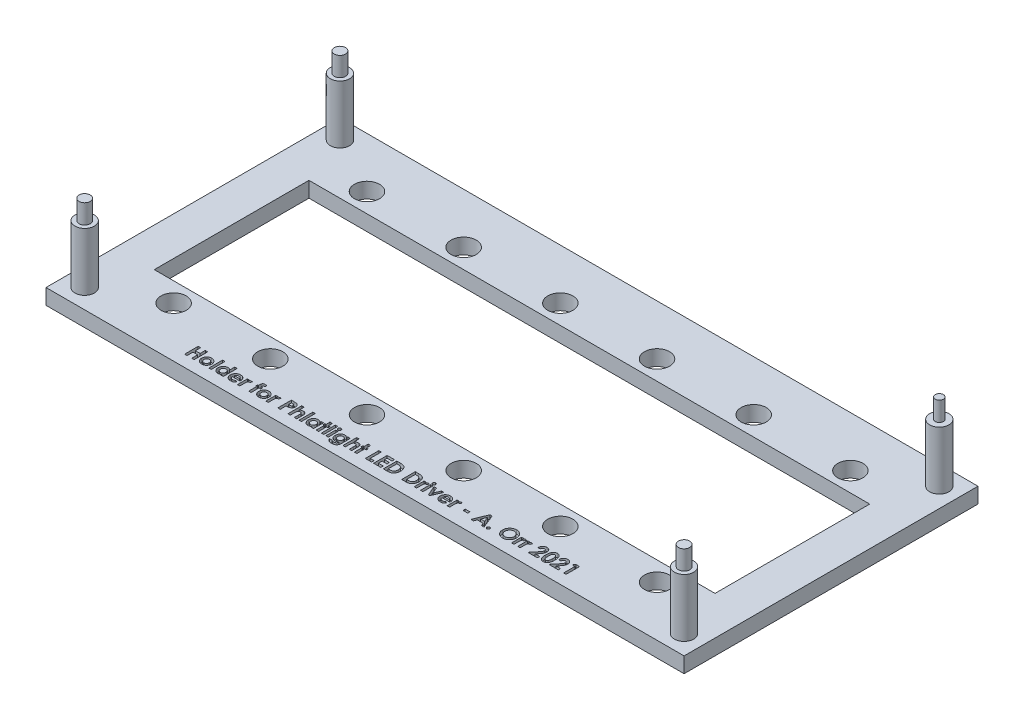
from build123d import *

# Parameters (mm, degrees)
SKETCH1_W           = 165
SKETCH1_H           = 76
BOSS_EXTRUDE1_DEPTH = 4
SKETCH2_R           = 2.5
BOSS_EXTRUDE2_DEPTH = 15
SKETCH3_R           = 1.05
SKETCH3_R_2         = 1.45
BOSS_EXTRUDE3_DEPTH = 5
SKETCH4_R           = 3.25
CUT_EXTRUDE1_DEPTH  = 97.717859219
SKETCH5_W           = 145
SKETCH5_H           = 40
CUT_EXTRUDE2_DEPTH  = 97.717859219
SKETCH6_W           = 0.628205128
SKETCH6_H           = 3.58974359
SKETCH6_W_2         = 0.628205129
SKETCH6_H_2         = 2.557692308
SKETCH6_W_3         = 1.211538461
SKETCH6_H_3         = 0.583333333
CUT_EXTRUDE3_DEPTH  = 1


with BuildPart() as part:
    # Sketch1 → Boss-Extrude1 (new body)
    with BuildSketch(Plane(origin=(0, 0, 0), x_dir=(1, 0, 0), z_dir=(0, 1, 0))):
        with Locations((1.371565063, 5.81671902)):
            Rectangle(SKETCH1_W, SKETCH1_H)
    extrude(amount=BOSS_EXTRUDE1_DEPTH)

    # Sketch2 → Boss-Extrude2 (add)
    with BuildSketch(Plane(origin=(0, 4, 0), x_dir=(1, 0, 0), z_dir=(0, 1, 0))):
        with Locations((-76.128434937, -27.18328098)):
            Circle(SKETCH2_R)
        with Locations((78.871565063, -27.18328098)):
            Circle(SKETCH2_R)
        with Locations((78.871565063, 38.81671902)):
            Circle(SKETCH2_R)
        with Locations((-76.128434937, 38.81671902)):
            Circle(SKETCH2_R)
    extrude(amount=BOSS_EXTRUDE2_DEPTH)

    # Sketch3 → Boss-Extrude3 (add)
    with BuildSketch(Plane(origin=(0, 19, 0), x_dir=(1, 0, 0), z_dir=(0, 1, 0))):
        with Locations((78.871565063, 38.81671902)):
            Circle(SKETCH3_R)
        with Locations((-76.128434937, -27.18328098)):
            Circle(SKETCH3_R_2)
        with Locations((78.871565063, -27.18328098)):
            Circle(SKETCH3_R_2)
        with Locations((-76.128434937, 38.81671902)):
            Circle(SKETCH3_R_2)
    extrude(amount=BOSS_EXTRUDE3_DEPTH)

    # Sketch4 → Cut-Extrude1 (cut, through all)
    with BuildSketch(Plane(origin=(0, 4, 0), x_dir=(1, 0, 0), z_dir=(0, 1, 0))):
        with Locations((-61.128434937, 30.81671902)):
            Circle(SKETCH4_R)
        with Locations((-36.128434937, 30.81671902)):
            Circle(SKETCH4_R)
        with Locations((-11.128434937, 30.81671902)):
            Circle(SKETCH4_R)
        with Locations((13.871565063, 30.81671902)):
            Circle(SKETCH4_R)
        with Locations((38.871565063, 30.81671902)):
            Circle(SKETCH4_R)
        with Locations((63.871565063, 30.81671902)):
            Circle(SKETCH4_R)
        with Locations((63.871565063, -19.18328098)):
            Circle(SKETCH4_R)
        with Locations((38.871565063, -19.18328098)):
            Circle(SKETCH4_R)
        with Locations((13.871565063, -19.18328098)):
            Circle(SKETCH4_R)
        with Locations((-11.128434937, -19.18328098)):
            Circle(SKETCH4_R)
        with Locations((-36.128434937, -19.18328098)):
            Circle(SKETCH4_R)
        with Locations((-61.128434937, -19.18328098)):
            Circle(SKETCH4_R)
    extrude(amount=-CUT_EXTRUDE1_DEPTH, mode=Mode.SUBTRACT)

    # Sketch5 → Cut-Extrude2 (cut, through all)
    with BuildSketch(Plane(origin=(0, 4, 0), x_dir=(1, 0, 0), z_dir=(0, 1, 0))):
        with Locations((1.371565063, 5.81671902)):
            Rectangle(SKETCH5_W, SKETCH5_H)
    extrude(amount=-CUT_EXTRUDE2_DEPTH, mode=Mode.SUBTRACT)

    # Sketch6 → Cut-Extrude3 (cut)
    # profile 1 of 40: a face of its own
    with BuildSketch(Plane(origin=(0, 4, 0), x_dir=(1, 0, 0), z_dir=(0, 1, 0))):
        Polygon((-48.279075962, -25.68328098), (-47.650870834, -25.68328098), (-47.650870834, -27.029434826), (-46.439332373, -27.029434826), (-46.439332373, -25.68328098), (-45.811127245, -25.68328098), (-45.811127245, -29.18328098), (-46.439332373, -29.18328098), (-46.439332373, -27.657639954), (-47.650870834, -27.657639954), (-47.650870834, -29.18328098), (-48.279075962, -29.18328098), align=None)
    # profile 2 of 40: a face of its own
    with BuildSketch(Plane(origin=(0, 4, 0), x_dir=(1, 0, 0), z_dir=(0, 1, 0))):
        with BuildLine():
            add(Edge.make_bspline(
                [(-43.874628847, -26.580716877), (-43.844928521, -26.581245415), (-43.786108419, -26.582292159), (-43.698503224, -26.591005346), (-43.612429569, -26.605221271), (-43.527392716, -26.623628413), (-43.444182311, -26.649419571), (-43.362361924, -26.680352078), (-43.281199978, -26.715866212), (-43.202710896, -26.758140455), (-43.126327654, -26.803990726), (-43.053911794, -26.854567337), (-42.986064681, -26.909473027), (-42.921526841, -26.967434762), (-42.863305842, -27.030976009), (-42.807681049, -27.097035083), (-42.757657735, -27.16797865), (-42.711343351, -27.24207798), (-42.670109989, -27.318904571), (-42.634306397, -27.39792399), (-42.603232246, -27.478043738), (-42.578901808, -27.560239727), (-42.558758448, -27.643428094), (-42.546046556, -27.728628251), (-42.537009282, -27.814964978), (-42.535995917, -27.873093968), (-42.535486219, -27.90233146)],
                knots=[0, 0, 0, 0, 1.022364134, 2.024744242, 3.027414945, 4.024939316, 5.017584196, 6.023349371, 7.035562955, 8.064994934, 9.090267829, 10.101425541, 11.102933353, 12.093946398, 13.084502048, 14.067315274, 15.065326281, 16.070028806, 17.074376865, 18.064572984, 19.055292013, 20.030201733, 21.013838017, 21.999348303, 22.993720005, 24, 24, 24, 24], degree=3))
            add(Edge.make_bspline(
                [(-42.535486219, -27.90233146), (-42.536024121, -27.931797371), (-42.537093592, -27.990382281), (-42.545719598, -28.077531112), (-42.559989937, -28.163131925), (-42.578467726, -28.247689011), (-42.604162367, -28.33012038), (-42.634183812, -28.411641103), (-42.671036316, -28.491140022), (-42.711779475, -28.569484396), (-42.758391641, -28.644368789), (-42.808371654, -28.71602304), (-42.863763463, -28.782567321), (-42.921518387, -28.846065356), (-42.984375873, -28.904369926), (-43.051332598, -28.958427742), (-43.121808903, -29.008899683), (-43.196311587, -29.054601584), (-43.273886394, -29.094758215), (-43.353225041, -29.130962695), (-43.434791455, -29.161105509), (-43.51841683, -29.185686144), (-43.604151883, -29.204718314), (-43.691807333, -29.217647094), (-43.781194401, -29.226638911), (-43.841419889, -29.227644905), (-43.87182436, -29.228152775)],
                knots=[0, 0, 0, 0, 1.012026251, 2.012137606, 3.004615893, 3.992048833, 4.982446996, 5.968083444, 6.973977695, 7.990229942, 8.999482246, 10.001782172, 10.988562221, 11.971415814, 12.948383116, 13.930088534, 14.925840678, 15.924049238, 16.929462851, 17.924729459, 18.917889337, 19.913673841, 20.916777188, 21.931792057, 22.95587778, 24, 24, 24, 24], degree=3))
            add(Edge.make_bspline(
                [(-43.87182436, -29.228152775), (-43.916281897, -29.226847858), (-44.003908379, -29.224275848), (-44.132961471, -29.206658252), (-44.256938891, -29.17633375), (-44.376042659, -29.134062064), (-44.490427493, -29.079892473), (-44.599095135, -29.012849377), (-44.703126531, -28.934252665), (-44.80071978, -28.844766641), (-44.890128416, -28.746592369), (-44.968237616, -28.641791933), (-45.034558649, -28.531936113), (-45.089031844, -28.416899639), (-45.131074043, -28.296524763), (-45.161435683, -28.171171364), (-45.179074819, -28.040487092), (-45.181625076, -27.951696428), (-45.182922116, -27.906538191)],
                knots=[0, 0, 0, 0, 1.029999031, 2.030143771, 3.011211297, 3.982305373, 4.953580601, 5.938004764, 6.935448627, 7.970290061, 9.001484052, 10.007591832, 10.993831261, 11.969999897, 12.951306496, 13.942897864, 14.953773953, 16, 16, 16, 16], degree=3))
            add(Edge.make_bspline(
                [(-45.182922116, -27.906538191), (-45.181579844, -27.858319094), (-45.178941634, -27.763545422), (-45.157993089, -27.624699835), (-45.124540523, -27.491761764), (-45.076521471, -27.365103082), (-45.015181356, -27.244490182), (-44.940298977, -27.130177451), (-44.851504261, -27.022138995), (-44.783505288, -26.956793633), (-44.748927725, -26.923565435)],
                knots=[0, 0, 0, 0, 1.043912699, 2.05178951, 3.033892, 4.007821512, 4.978932272, 5.95884105, 6.962068106, 8, 8, 8, 8], degree=3))
            add(Edge.make_bspline(
                [(-44.748927725, -26.923565435), (-44.717199355, -26.896022996), (-44.654605849, -26.841687465), (-44.552912001, -26.772771752), (-44.448788977, -26.713249601), (-44.340988817, -26.664311323), (-44.229211001, -26.62741265), (-44.114028328, -26.600553718), (-43.995464748, -26.584056175), (-43.915112172, -26.581835633), (-43.874628847, -26.580716877)],
                knots=[0, 0, 0, 0, 1.048115528, 2.067714963, 3.060638214, 4.039924844, 5.017819947, 5.994373833, 6.98952318, 8, 8, 8, 8], degree=3))
        make_face()
        with BuildLine():
            add(Edge.make_bspline(
                [(-43.860606411, -27.16405021), (-43.88492879, -27.164858606), (-43.932807654, -27.166449941), (-44.0032866, -27.17499021), (-44.069946329, -27.192494225), (-44.134110828, -27.214754542), (-44.194645021, -27.244524579), (-44.253206723, -27.279362383), (-44.306750855, -27.322957607), (-44.357868588, -27.37077838), (-44.404272096, -27.423882064), (-44.443812291, -27.481738488), (-44.479142331, -27.542134186), (-44.505931309, -27.607280321), (-44.528101749, -27.675396259), (-44.543106437, -27.747582547), (-44.553548652, -27.823032824), (-44.554323839, -27.874716782), (-44.554716988, -27.900929217)],
                knots=[0, 0, 0, 0, 1.030650113, 2.02884584, 2.99876339, 3.944280128, 4.900564847, 5.851248946, 6.823638398, 7.81794922, 8.81432732, 9.802856497, 10.78262424, 11.771747962, 12.779760563, 13.812642396, 14.89064281, 16, 16, 16, 16], degree=3))
            add(Edge.make_bspline(
                [(-44.554716988, -27.900929217), (-44.55425695, -27.928066034), (-44.553357893, -27.981099733), (-44.544047971, -28.058536065), (-44.528695603, -28.132022631), (-44.506884699, -28.201445909), (-44.479453804, -28.267304212), (-44.445799278, -28.329228031), (-44.405565933, -28.38684504), (-44.359951086, -28.440084289), (-44.310004776, -28.488410145), (-44.255277515, -28.529881586), (-44.198061073, -28.565914765), (-44.137036874, -28.594854968), (-44.073071636, -28.617199154), (-44.005975473, -28.633650426), (-43.935395794, -28.642513574), (-43.887271607, -28.64404025), (-43.862709777, -28.644819441)],
                knots=[0, 0, 0, 0, 1.141730614, 2.231293227, 3.276944405, 4.297399982, 5.28939179, 6.275415646, 7.257752684, 8.24146775, 9.222424823, 10.176631434, 11.126518621, 12.063689483, 13.012557477, 13.974037417, 14.965980454, 16, 16, 16, 16], degree=3))
            add(Edge.make_bspline(
                [(-43.862709777, -28.644819441), (-43.838135661, -28.644128333), (-43.78995613, -28.642773361), (-43.719293568, -28.632626758), (-43.651854763, -28.616658005), (-43.587343212, -28.594121512), (-43.526280497, -28.564561858), (-43.468432865, -28.528356293), (-43.413291423, -28.486308021), (-43.362674829, -28.437070348), (-43.315820016, -28.383665064), (-43.274731147, -28.325743899), (-43.240395739, -28.263820065), (-43.212234556, -28.198283187), (-43.190380896, -28.129223347), (-43.175282689, -28.056383856), (-43.164834891, -27.97999045), (-43.164077236, -27.927608431), (-43.163691347, -27.900929217)],
                knots=[0, 0, 0, 0, 1.031504075, 2.022346795, 2.991027682, 3.937587355, 4.885570121, 5.833146507, 6.798790848, 7.791235734, 8.792807298, 9.778388351, 10.766749885, 11.760164525, 12.768777521, 13.802286646, 14.880660483, 16, 16, 16, 16], degree=3))
            add(Edge.make_bspline(
                [(-43.163691347, -27.900929217), (-43.164157238, -27.874259328), (-43.165071467, -27.821924353), (-43.174382052, -27.745427626), (-43.189583756, -27.672823573), (-43.211675973, -27.604422207), (-43.238943822, -27.539443177), (-43.27262161, -27.478219085), (-43.313053373, -27.421051477), (-43.358889967, -27.368223821), (-43.409585003, -27.320576087), (-43.463362067, -27.278085875), (-43.521450876, -27.242943205), (-43.582761647, -27.2139731), (-43.647457501, -27.19168474), (-43.715465805, -27.175140234), (-43.786994984, -27.166403205), (-43.835812826, -27.164842739), (-43.860606411, -27.16405021)],
                knots=[0, 0, 0, 0, 1.123894411, 2.205445421, 3.243160173, 4.246488011, 5.231014757, 6.210004299, 7.185865357, 8.177612767, 9.153374344, 10.115157457, 11.061423229, 12.009021698, 12.96873347, 13.94135618, 14.954456845, 16, 16, 16, 16], degree=3))
        make_face(mode=Mode.SUBTRACT)
    # profile 3 of 40: a face of its own
    with BuildSketch(Plane(origin=(0, 4, 0), x_dir=(1, 0, 0), z_dir=(0, 1, 0))):
        with Locations((-41.727793911, -27.388409185)):
            Rectangle(SKETCH6_W, SKETCH6_H)
    # profile 4 of 40: a face of its own
    with BuildSketch(Plane(origin=(0, 4, 0), x_dir=(1, 0, 0), z_dir=(0, 1, 0))):
        with BuildLine():
            Line((-38.900870834, -25.59353739), (-38.272665706, -25.59353739))
            Line((-38.272665706, -25.59353739), (-38.272665706, -29.18328098))
            Line((-38.272665706, -29.18328098), (-38.900870834, -29.18328098))
            Line((-38.900870834, -29.18328098), (-38.900870834, -28.904234505))
            add(Edge.make_bspline(
                [(-38.900870834, -28.904234505), (-38.931998167, -28.931396591), (-38.992410173, -28.984112836), (-39.087599945, -29.052513504), (-39.183067873, -29.108935215), (-39.279272683, -29.15387203), (-39.377693002, -29.187053243), (-39.479037417, -29.211077217), (-39.584765395, -29.225244742), (-39.656637818, -29.227173333), (-39.693138462, -29.228152775)],
                knots=[0, 0, 0, 0, 1.129196829, 2.191548051, 3.199897424, 4.157751732, 5.089409408, 6.034969131, 7.002052659, 8, 8, 8, 8], degree=3))
            add(Edge.make_bspline(
                [(-39.693138462, -29.228152775), (-39.734112059, -29.227230997), (-39.815078207, -29.225409512), (-39.93388704, -29.206235442), (-40.048608781, -29.176885255), (-40.159150306, -29.135351072), (-40.265310496, -29.081530913), (-40.367901797, -29.016829022), (-40.465165483, -28.938973975), (-40.55791124, -28.851334361), (-40.642828699, -28.754930163), (-40.717064343, -28.651099456), (-40.779639474, -28.541314851), (-40.83090393, -28.425940334), (-40.871230045, -28.305060584), (-40.899976794, -28.178292206), (-40.91693741, -28.045589925), (-40.919036656, -27.955198328), (-40.920101604, -27.909342678)],
                knots=[0, 0, 0, 0, 0.980476535, 1.937477201, 2.874147792, 3.812856188, 4.758993464, 5.720109578, 6.712210464, 7.737600662, 8.772720504, 9.783789959, 10.789002326, 11.793715968, 12.802552247, 13.835794126, 14.902098527, 16, 16, 16, 16], degree=3))
            add(Edge.make_bspline(
                [(-40.920101604, -27.909342678), (-40.918983937, -27.861859092), (-40.91679151, -27.768714748), (-40.900754037, -27.632029851), (-40.872537773, -27.502118262), (-40.834062869, -27.378800033), (-40.784571586, -27.262053861), (-40.72429451, -27.151688477), (-40.652411627, -27.04799236), (-40.569579349, -26.95273049), (-40.480140832, -26.865418384), (-40.384457431, -26.789406272), (-40.284025424, -26.724830446), (-40.178738085, -26.672111513), (-40.068610449, -26.631372989), (-39.954077298, -26.601589801), (-39.834630187, -26.583718842), (-39.753261847, -26.581725842), (-39.712068751, -26.580716877)],
                knots=[0, 0, 0, 0, 1.136281865, 2.228943489, 3.287578264, 4.313574083, 5.316051562, 6.317280042, 7.318008486, 8.329309503, 9.333984563, 10.305318864, 11.248632312, 12.186624717, 13.117503092, 14.05354244, 15.014596925, 16, 16, 16, 16], degree=3))
            add(Edge.make_bspline(
                [(-39.712068751, -26.580716877), (-39.673935197, -26.581926734), (-39.598526092, -26.584319226), (-39.487133855, -26.599379365), (-39.379953367, -26.627736294), (-39.275682926, -26.664272113), (-39.175676681, -26.713436862), (-39.079397347, -26.772495496), (-38.986591241, -26.842198044), (-38.92980553, -26.896100088), (-38.900870834, -26.923565435)],
                knots=[0, 0, 0, 0, 1.011899165, 2.001030639, 2.974036179, 3.948778736, 4.92769327, 5.924124564, 6.942254589, 8, 8, 8, 8], degree=3))
            Line((-38.900870834, -26.923565435), (-38.900870834, -25.59353739))
        make_face()
        with BuildLine():
            add(Edge.make_bspline(
                [(-39.580257854, -27.16405021), (-39.605289976, -27.164818282), (-39.654351302, -27.166323653), (-39.726502695, -27.175378564), (-39.795457783, -27.191333719), (-39.860724783, -27.214904036), (-39.923276412, -27.243616116), (-39.982162816, -27.279577523), (-40.03787, -27.322083142), (-40.090070345, -27.370103913), (-40.137658651, -27.42288752), (-40.178682549, -27.480485871), (-40.213546234, -27.541347019), (-40.24303185, -27.605653951), (-40.264136862, -27.674167618), (-40.280852023, -27.745996093), (-40.289526109, -27.821726179), (-40.291098447, -27.873333889), (-40.291896475, -27.899526973)],
                knots=[0, 0, 0, 0, 1.04836806, 2.054732945, 3.03993516, 4.00574415, 4.955904794, 5.917688631, 6.888591924, 7.88601754, 8.884115178, 9.859153345, 10.841239365, 11.818093293, 12.814750328, 13.83810466, 14.90274714, 16, 16, 16, 16], degree=3))
            add(Edge.make_bspline(
                [(-40.291896475, -27.899526973), (-40.291110638, -27.925957644), (-40.289562153, -27.978038974), (-40.280711771, -28.054407871), (-40.264598091, -28.127285591), (-40.241088839, -28.19608297), (-40.21237859, -28.26172831), (-40.17743176, -28.323918653), (-40.1345057, -28.381554395), (-40.086875677, -28.435999392), (-40.03360445, -28.484616662), (-39.977582052, -28.527784333), (-39.918043262, -28.563902696), (-39.855634033, -28.593093786), (-39.790564437, -28.61688207), (-39.7220187, -28.632636702), (-39.650668314, -28.642708341), (-39.602026871, -28.644110882), (-39.577453366, -28.644819441)],
                knots=[0, 0, 0, 0, 1.099136573, 2.165835871, 3.191374663, 4.196217796, 5.183857741, 6.167377911, 7.154730987, 8.166690795, 9.170734848, 10.148332609, 11.103258353, 12.059567475, 13.009337315, 13.978056681, 14.978520572, 16, 16, 16, 16], degree=3))
            add(Edge.make_bspline(
                [(-39.577453366, -28.644819441), (-39.551954991, -28.644047063), (-39.501964315, -28.642532783), (-39.428635808, -28.633560508), (-39.358754406, -28.617546851), (-39.292610853, -28.593841589), (-39.22919487, -28.565335605), (-39.169078729, -28.530076912), (-39.11291478, -28.487668831), (-39.060418579, -28.439213951), (-39.012315931, -28.385999335), (-38.970724705, -28.327645672), (-38.934497227, -28.266019275), (-38.906005981, -28.199663069), (-38.883379937, -28.12973798), (-38.867146272, -28.055810036), (-38.858316099, -27.977799535), (-38.856781158, -27.924554328), (-38.855999039, -27.897423608)],
                knots=[0, 0, 0, 0, 1.050008698, 2.058587853, 3.036635738, 3.995319155, 4.947022481, 5.895997462, 6.858296291, 7.838991643, 8.833936038, 9.806048392, 10.784806122, 11.771666913, 12.772873988, 13.80724452, 14.882696879, 16, 16, 16, 16], degree=3))
            add(Edge.make_bspline(
                [(-38.855999039, -27.897423608), (-38.856771439, -27.870759523), (-38.858280161, -27.81867682), (-38.867184354, -27.742295141), (-38.883533269, -27.669818805), (-38.905693632, -27.601114589), (-38.934691745, -27.536339587), (-38.970946635, -27.476211997), (-39.012081628, -27.418648625), (-39.060716843, -27.366871629), (-39.11292866, -27.3187676), (-39.16991859, -27.277641971), (-39.229891143, -27.242198762), (-39.293214789, -27.213098521), (-39.360475877, -27.191766941), (-39.430476701, -27.17525068), (-39.50430942, -27.166329088), (-39.554528578, -27.164822232), (-39.580257854, -27.16405021)],
                knots=[0, 0, 0, 0, 1.106611376, 2.161533483, 3.185006901, 4.184773755, 5.152708835, 6.122342771, 7.094156588, 8.082475533, 9.064254463, 10.03606828, 10.992420271, 11.951521816, 12.920622147, 13.915721683, 14.932141191, 16, 16, 16, 16], degree=3))
        make_face(mode=Mode.SUBTRACT)
    # profile 5 of 40: a face of its own
    with BuildSketch(Plane(origin=(0, 4, 0), x_dir=(1, 0, 0), z_dir=(0, 1, 0))):
        with BuildLine():
            Line((-35.088871636, -28.061486108), (-37.105999039, -28.061486108))
            add(Edge.make_bspline(
                [(-37.105999039, -28.061486108), (-37.10188628, -28.084923984), (-37.093804382, -28.13098126), (-37.076254254, -28.197883449), (-37.053857658, -28.260930943), (-37.027016749, -28.320208021), (-36.996184063, -28.376028057), (-36.96022029, -28.428129234), (-36.919581596, -28.476465531), (-36.874502945, -28.520826876), (-36.825735715, -28.560575603), (-36.773516409, -28.595398), (-36.71779114, -28.623950235), (-36.659198779, -28.648016807), (-36.597301503, -28.667079969), (-36.532008218, -28.68022747), (-36.463492004, -28.687993747), (-36.416816667, -28.68911705), (-36.392958174, -28.689691236)],
                knots=[0, 0, 0, 0, 1.091296461, 2.144483647, 3.168565212, 4.157007626, 5.126487748, 6.090021542, 7.05641414, 8.019231907, 8.98705074, 9.938580405, 10.892824166, 11.854447369, 12.841318655, 13.858982407, 14.905600794, 16, 16, 16, 16], degree=3))
            add(Edge.make_bspline(
                [(-36.392958174, -28.689691236), (-36.364159354, -28.688930919), (-36.307445996, -28.687433632), (-36.224360504, -28.674154916), (-36.14400473, -28.654098), (-36.067139123, -28.624271681), (-35.992873317, -28.587143158), (-35.922429953, -28.540885586), (-35.854589713, -28.486850764), (-35.813199172, -28.445200744), (-35.792096796, -28.423966076)],
                knots=[0, 0, 0, 0, 1.021034703, 2.010718019, 2.977989445, 3.954245119, 4.929443971, 5.918328161, 6.938689359, 8, 8, 8, 8], degree=3))
            Line((-35.792096796, -28.423966076), (-35.26625545, -28.674266557))
            add(Edge.make_bspline(
                [(-35.26625545, -28.674266557), (-35.282811258, -28.697144142), (-35.315615982, -28.742475237), (-35.369168594, -28.806267794), (-35.425054154, -28.865788838), (-35.483314343, -28.92064689), (-35.544023048, -28.970685626), (-35.607011392, -29.016514607), (-35.673199925, -29.056903345), (-35.741265219, -29.093805822), (-35.812614309, -29.125442145), (-35.88704974, -29.152420484), (-35.964256238, -29.176808673), (-36.045208753, -29.195391136), (-36.129233194, -29.210100863), (-36.216530565, -29.220546718), (-36.30708936, -29.226998622), (-36.368641645, -29.227763487), (-36.399969392, -29.228152775)],
                knots=[0, 0, 0, 0, 1.028154879, 2.037251081, 3.030720504, 4.000128189, 4.949298328, 5.894184978, 6.834267904, 7.770992897, 8.712077017, 9.673380525, 10.653304757, 11.658697181, 12.695551717, 13.758623199, 14.859225354, 16, 16, 16, 16], degree=3))
            add(Edge.make_bspline(
                [(-36.399969392, -29.228152775), (-36.448166617, -29.227170178), (-36.542558104, -29.22524582), (-36.680622717, -29.207385019), (-36.811745806, -29.177769887), (-36.936297617, -29.137512663), (-37.053739753, -29.084360516), (-37.164130337, -29.019351031), (-37.26857233, -28.943730569), (-37.363874444, -28.85591206), (-37.450697481, -28.760326833), (-37.526957439, -28.657674827), (-37.590770686, -28.548673232), (-37.643175408, -28.434043443), (-37.683906178, -28.313492054), (-37.713270701, -28.186966457), (-37.731271505, -28.054527085), (-37.733215682, -27.964321089), (-37.734204168, -27.918457262)],
                knots=[0, 0, 0, 0, 1.103565453, 2.161269334, 3.182010356, 4.179077853, 5.15417608, 6.128274628, 7.109042802, 8.101804412, 9.090965879, 10.063106201, 11.02526161, 11.978650795, 12.945248442, 13.93468508, 14.949922959, 16, 16, 16, 16], degree=3))
            add(Edge.make_bspline(
                [(-37.734204168, -27.918457262), (-37.733205953, -27.871427976), (-37.73124201, -27.778899969), (-37.713425688, -27.643402511), (-37.683824995, -27.514119609), (-37.642975079, -27.390873227), (-37.591365343, -27.273277904), (-37.526740182, -27.162362457), (-37.450735325, -27.057740739), (-37.364225066, -26.959902181), (-37.268519222, -26.871592193), (-37.166822722, -26.792890346), (-37.0579929, -26.727310743), (-36.943260715, -26.674322465), (-36.823360036, -26.631270826), (-36.696904978, -26.602623556), (-36.564857672, -26.583388629), (-36.474593042, -26.581617213), (-36.428715386, -26.580716877)],
                knots=[0, 0, 0, 0, 1.079208495, 2.12329425, 3.130605359, 4.119693003, 5.099659317, 6.073216462, 7.060498243, 8.06384408, 9.066070512, 10.045757761, 11.010926815, 11.975797609, 12.942977511, 13.929384301, 14.947594487, 16, 16, 16, 16], degree=3))
            add(Edge.make_bspline(
                [(-36.428715386, -26.580716877), (-36.380287263, -26.581714718), (-36.285203636, -26.583673875), (-36.146177445, -26.60138965), (-36.014183715, -26.631185372), (-35.888660077, -26.671094499), (-35.771209521, -26.725589325), (-35.659251302, -26.78899903), (-35.555470812, -26.866254085), (-35.458761862, -26.953642839), (-35.37146227, -27.050597633), (-35.295152754, -27.155920234), (-35.230222748, -27.268582757), (-35.177596333, -27.38904207), (-35.136907386, -27.516936544), (-35.107515681, -27.652100082), (-35.08965218, -27.795046782), (-35.08774418, -27.89293058), (-35.08676827, -27.942996525)],
                knots=[0, 0, 0, 0, 1.080001299, 2.120471247, 3.119684163, 4.095710327, 5.052285597, 6.002875087, 6.961153713, 7.931888285, 8.906493152, 9.865905668, 10.82813294, 11.801621613, 12.7925306, 13.817193356, 14.883530496, 16, 16, 16, 16], degree=3))
            Line((-35.08676827, -27.942996525), (-35.088871636, -28.061486108))
        make_face()
        with BuildLine():
            add(Edge.make_bspline(
                [(-35.714973398, -27.567896364), (-35.726828013, -27.53590556), (-35.750398076, -27.472299509), (-35.803641867, -27.384538678), (-35.874294674, -27.308534234), (-35.956468957, -27.241246897), (-36.05035822, -27.186632291), (-36.15300385, -27.147089543), (-36.263108423, -27.123379215), (-36.338854437, -27.12059841), (-36.377533495, -27.119178416)],
                knots=[0, 0, 0, 0, 0.954238005, 1.897273737, 2.851915805, 3.847685534, 4.862635127, 5.880135777, 6.917509367, 8, 8, 8, 8], degree=3))
            add(Edge.make_bspline(
                [(-36.377533495, -27.119178416), (-36.419777323, -27.120542493), (-36.502355211, -27.123208981), (-36.621468193, -27.151568054), (-36.733824488, -27.193893123), (-36.800063392, -27.237531168), (-36.833262661, -27.259402775)],
                knots=[0, 0, 0, 0, 1.044195649, 2.041185066, 3.018232172, 4, 4, 4, 4], degree=3))
            add(Edge.make_bspline(
                [(-36.833262661, -27.259402775), (-36.853976526, -27.276060669), (-36.898137426, -27.311574448), (-36.955489314, -27.382421066), (-37.011981402, -27.468200417), (-37.044100268, -27.533355893), (-37.061127245, -27.567896364)],
                knots=[0, 0, 0, 0, 0.82159062, 1.751589201, 2.808063854, 4, 4, 4, 4], degree=3))
            Line((-37.061127245, -27.567896364), (-35.714973398, -27.567896364))
        make_face(mode=Mode.SUBTRACT)
    # profile 6 of 40: a face of its own
    with BuildSketch(Plane(origin=(0, 4, 0), x_dir=(1, 0, 0), z_dir=(0, 1, 0))):
        with BuildLine():
            Line((-34.638050321, -26.625588672), (-34.099588783, -26.625588672))
            Line((-34.099588783, -26.625588672), (-34.099588783, -26.940392358))
            add(Edge.make_bspline(
                [(-34.099588783, -26.940392358), (-34.08435674, -26.912415668), (-34.054585079, -26.857734066), (-33.999892042, -26.784334845), (-33.937058466, -26.722520068), (-33.868342156, -26.670996825), (-33.793534845, -26.630839515), (-33.714639741, -26.60222237), (-33.632331789, -26.583625191), (-33.576184095, -26.581693295), (-33.54780593, -26.580716877)],
                knots=[0, 0, 0, 0, 1.09866127, 2.147379032, 3.14564304, 4.131443017, 5.102343063, 6.064490016, 7.021754664, 8, 8, 8, 8], degree=3))
            add(Edge.make_bspline(
                [(-33.54780593, -26.580716877), (-33.527199842, -26.581681782), (-33.485238489, -26.583646674), (-33.421283481, -26.59506862), (-33.356405715, -26.615721671), (-33.313710554, -26.634316998), (-33.291896475, -26.643817839)],
                knots=[0, 0, 0, 0, 0.931404136, 1.896671404, 2.925354185, 4, 4, 4, 4], degree=3))
            Line((-33.291896475, -26.643817839), (-33.486808334, -27.175969281))
            add(Edge.make_bspline(
                [(-33.486808334, -27.175969281), (-33.504230671, -27.16755165), (-33.536977958, -27.151729745), (-33.584521332, -27.133058266), (-33.627668915, -27.121665842), (-33.65502369, -27.119965993), (-33.667697757, -27.119178416)],
                knots=[0, 0, 0, 0, 1.214386998, 2.282580073, 3.20428172, 4, 4, 4, 4], degree=3))
            add(Edge.make_bspline(
                [(-33.667697757, -27.119178416), (-33.679664541, -27.119700306), (-33.703205267, -27.120726954), (-33.73795072, -27.129524983), (-33.7706737, -27.14469691), (-33.802951129, -27.164133655), (-33.832236672, -27.191152184), (-33.861504127, -27.222430929), (-33.887296176, -27.261048699), (-33.914514267, -27.304032239), (-33.937689498, -27.356644053), (-33.957561545, -27.419451717), (-33.975267699, -27.493181958), (-33.98745195, -27.578226249), (-33.999228518, -27.673761639), (-34.00623822, -27.780489346), (-34.01146264, -27.898071886), (-34.011782078, -27.980148743), (-34.011948559, -28.022924409)],
                knots=[0, 0, 0, 0, 0.544232178, 1.070598461, 1.618251235, 2.182094276, 2.777567932, 3.425210017, 4.127676488, 4.886675562, 5.738955394, 6.734782583, 7.883056018, 9.186093582, 10.642914445, 12.264202625, 14.053029461, 16, 16, 16, 16], degree=3))
            Line((-34.011948559, -28.022924409), (-34.009845193, -28.147724089))
            Line((-34.009845193, -28.147724089), (-34.009845193, -29.18328098))
            Line((-34.009845193, -29.18328098), (-34.638050321, -29.18328098))
            Line((-34.638050321, -29.18328098), (-34.638050321, -26.625588672))
        make_face()
    # profile 7 of 40: a face of its own
    with BuildSketch(Plane(origin=(0, 4, 0), x_dir=(1, 0, 0), z_dir=(0, 1, 0))):
        with BuildLine():
            Line((-31.945742629, -26.625588672), (-31.721383655, -26.625588672))
            add(Edge.make_bspline(
                [(-31.721383655, -26.625588672), (-31.721233721, -26.5849228), (-31.720950217, -26.508029166), (-31.71927589, -26.399126388), (-31.718146809, -26.303297005), (-31.716130021, -26.220555756), (-31.713291607, -26.151145006), (-31.710381933, -26.095068548), (-31.708202392, -26.051972573), (-31.705129528, -26.027755678), (-31.70385561, -26.017716076)],
                knots=[0, 0, 0, 0, 1.604323161, 3.033556972, 4.296844687, 5.385167547, 6.298701784, 7.037230881, 7.60086462, 8, 8, 8, 8], degree=3))
            add(Edge.make_bspline(
                [(-31.70385561, -26.017716076), (-31.697882056, -25.983271465), (-31.686237579, -25.916127263), (-31.647690598, -25.822541842), (-31.591678727, -25.741018227), (-31.532302706, -25.683474549), (-31.477276356, -25.644190937), (-31.431113821, -25.618533404), (-31.380920476, -25.596537056), (-31.326534147, -25.579289283), (-31.268472085, -25.565200057), (-31.206107699, -25.555405926), (-31.139783141, -25.550008501), (-31.094122941, -25.549120365), (-31.070742629, -25.548665595)],
                knots=[0, 0, 0, 0, 1.43722947, 2.801646624, 4.13175475, 5.486897933, 6.18427957, 6.91287343, 7.658885333, 8.438447905, 9.260561323, 10.118602268, 11.036630026, 12, 12, 12, 12], degree=3))
            add(Edge.make_bspline(
                [(-31.070742629, -25.548665595), (-31.034920147, -25.54978349), (-30.960309122, -25.552111839), (-30.84567535, -25.570935113), (-30.724056916, -25.599750498), (-30.642178235, -25.626564936), (-30.599588783, -25.64051255)],
                knots=[0, 0, 0, 0, 0.891275659, 1.856347963, 2.884972697, 4, 4, 4, 4], degree=3))
            Line((-30.599588783, -25.64051255), (-30.599588783, -26.129194441))
            add(Edge.make_bspline(
                [(-30.599588783, -26.129194441), (-30.622432267, -26.122878603), (-30.665999897, -26.110832888), (-30.728686814, -26.097461074), (-30.785169627, -26.089204012), (-30.820653404, -26.087789496), (-30.837269071, -26.087127133)],
                knots=[0, 0, 0, 0, 1.174725213, 2.24046353, 3.176077791, 4, 4, 4, 4], degree=3))
            add(Edge.make_bspline(
                [(-30.837269071, -26.087127133), (-30.855555782, -26.087512492), (-30.889822259, -26.088234594), (-30.937320583, -26.097421143), (-30.977989276, -26.111885772), (-30.99908361, -26.128405426), (-31.009043911, -26.136205659)],
                knots=[0, 0, 0, 0, 1.199997209, 2.248609783, 3.173030359, 4, 4, 4, 4], degree=3))
            add(Edge.make_bspline(
                [(-31.009043911, -26.136205659), (-31.015071135, -26.143904928), (-31.028387242, -26.160915128), (-31.040490729, -26.195625546), (-31.046635535, -26.239496451), (-31.047715197, -26.271963193), (-31.048306732, -26.289751332)],
                knots=[0, 0, 0, 0, 0.721105823, 1.593158367, 2.681320256, 4, 4, 4, 4], degree=3))
            Line((-31.048306732, -26.289751332), (-31.050410097, -26.625588672))
            Line((-31.050410097, -26.625588672), (-30.644460578, -26.625588672))
            Line((-30.644460578, -26.625588672), (-30.644460578, -27.16405021))
            Line((-30.644460578, -27.16405021), (-31.093178527, -27.16405021))
            Line((-31.093178527, -27.16405021), (-31.093178527, -29.18328098))
            Line((-31.093178527, -29.18328098), (-31.721383655, -29.18328098))
            Line((-31.721383655, -29.18328098), (-31.721383655, -27.16405021))
            Line((-31.721383655, -27.16405021), (-31.945742629, -27.16405021))
            Line((-31.945742629, -27.16405021), (-31.945742629, -26.625588672))
        make_face()
    # profile 8 of 40: a face of its own
    with BuildSketch(Plane(origin=(0, 4, 0), x_dir=(1, 0, 0), z_dir=(0, 1, 0))):
        with BuildLine():
            add(Edge.make_bspline(
                [(-29.066936539, -26.580716877), (-29.037236214, -26.581245415), (-28.978416111, -26.582292159), (-28.890810916, -26.591005346), (-28.804737262, -26.605221271), (-28.719700409, -26.623628413), (-28.636490003, -26.649419571), (-28.554669616, -26.680352078), (-28.47350767, -26.715866212), (-28.395018589, -26.758140455), (-28.318635346, -26.803990726), (-28.246219487, -26.854567337), (-28.178372373, -26.909473027), (-28.113834533, -26.967434762), (-28.055613534, -27.030976009), (-27.999988741, -27.097035083), (-27.949965427, -27.16797865), (-27.903651044, -27.24207798), (-27.862417681, -27.318904571), (-27.826614089, -27.39792399), (-27.795539938, -27.478043738), (-27.7712095, -27.560239727), (-27.75106614, -27.643428094), (-27.738354248, -27.728628251), (-27.729316974, -27.814964978), (-27.728303609, -27.873093968), (-27.727793911, -27.90233146)],
                knots=[0, 0, 0, 0, 1.022364134, 2.024744242, 3.027414945, 4.024939316, 5.017584196, 6.023349371, 7.035562955, 8.064994934, 9.090267829, 10.101425541, 11.102933353, 12.093946398, 13.084502048, 14.067315274, 15.065326281, 16.070028806, 17.074376865, 18.064572984, 19.055292013, 20.030201733, 21.013838017, 21.999348303, 22.993720005, 24, 24, 24, 24], degree=3))
            add(Edge.make_bspline(
                [(-27.727793911, -27.90233146), (-27.728331813, -27.931797371), (-27.729401285, -27.990382281), (-27.738027291, -28.077531112), (-27.75229763, -28.163131925), (-27.770775419, -28.247689011), (-27.796470059, -28.33012038), (-27.826491504, -28.411641103), (-27.863344009, -28.491140022), (-27.904087168, -28.569484396), (-27.950699333, -28.644368789), (-28.000679347, -28.71602304), (-28.056071155, -28.782567321), (-28.113826079, -28.846065356), (-28.176683565, -28.904369926), (-28.24364029, -28.958427742), (-28.314116595, -29.008899683), (-28.388619279, -29.054601584), (-28.466194086, -29.094758215), (-28.545532733, -29.130962695), (-28.627099147, -29.161105509), (-28.710724523, -29.185686144), (-28.796459576, -29.204718314), (-28.884115025, -29.217647094), (-28.973502094, -29.226638911), (-29.033727581, -29.227644905), (-29.064132052, -29.228152775)],
                knots=[0, 0, 0, 0, 1.012026251, 2.012137606, 3.004615893, 3.992048833, 4.982446996, 5.968083444, 6.973977695, 7.990229942, 8.999482246, 10.001782172, 10.988562221, 11.971415814, 12.948383116, 13.930088534, 14.925840678, 15.924049238, 16.929462851, 17.924729459, 18.917889337, 19.913673841, 20.916777188, 21.931792057, 22.95587778, 24, 24, 24, 24], degree=3))
            add(Edge.make_bspline(
                [(-29.064132052, -29.228152775), (-29.108589589, -29.226847858), (-29.196216072, -29.224275848), (-29.325269163, -29.206658252), (-29.449246583, -29.17633375), (-29.568350351, -29.134062064), (-29.682735186, -29.079892473), (-29.791402828, -29.012849377), (-29.895434224, -28.934252665), (-29.993027472, -28.844766641), (-30.082436108, -28.746592369), (-30.160545309, -28.641791933), (-30.226866341, -28.531936113), (-30.281339536, -28.416899639), (-30.323381735, -28.296524763), (-30.353743376, -28.171171364), (-30.371382511, -28.040487092), (-30.373932768, -27.951696428), (-30.375229809, -27.906538191)],
                knots=[0, 0, 0, 0, 1.029999031, 2.030143771, 3.011211297, 3.982305373, 4.953580601, 5.938004764, 6.935448627, 7.970290061, 9.001484052, 10.007591832, 10.993831261, 11.969999897, 12.951306496, 13.942897864, 14.953773953, 16, 16, 16, 16], degree=3))
            add(Edge.make_bspline(
                [(-30.375229809, -27.906538191), (-30.373887536, -27.858319094), (-30.371249327, -27.763545422), (-30.350300782, -27.624699835), (-30.316848215, -27.491761764), (-30.268829164, -27.365103082), (-30.207489048, -27.244490182), (-30.132606669, -27.130177451), (-30.043811953, -27.022138995), (-29.975812981, -26.956793633), (-29.941235418, -26.923565435)],
                knots=[0, 0, 0, 0, 1.043912699, 2.05178951, 3.033892, 4.007821512, 4.978932272, 5.95884105, 6.962068106, 8, 8, 8, 8], degree=3))
            add(Edge.make_bspline(
                [(-29.941235418, -26.923565435), (-29.909507047, -26.896022996), (-29.846913541, -26.841687465), (-29.745219694, -26.772771752), (-29.64109667, -26.713249601), (-29.533296509, -26.664311323), (-29.421518694, -26.62741265), (-29.30633602, -26.600553718), (-29.18777244, -26.584056175), (-29.107419864, -26.581835633), (-29.066936539, -26.580716877)],
                knots=[0, 0, 0, 0, 1.048115528, 2.067714963, 3.060638214, 4.039924844, 5.017819947, 5.994373833, 6.98952318, 8, 8, 8, 8], degree=3))
        make_face()
        with BuildLine():
            add(Edge.make_bspline(
                [(-29.052914104, -27.16405021), (-29.077236482, -27.164858606), (-29.125115346, -27.166449941), (-29.195594292, -27.17499021), (-29.262254022, -27.192494225), (-29.326418521, -27.214754542), (-29.386952713, -27.244524579), (-29.445514415, -27.279362383), (-29.499058547, -27.322957607), (-29.55017628, -27.37077838), (-29.596579788, -27.423882064), (-29.636119983, -27.481738488), (-29.671450023, -27.542134186), (-29.698239001, -27.607280321), (-29.720409441, -27.675396259), (-29.735414129, -27.747582547), (-29.745856344, -27.823032824), (-29.746631531, -27.874716782), (-29.74702468, -27.900929217)],
                knots=[0, 0, 0, 0, 1.030650113, 2.02884584, 2.99876339, 3.944280128, 4.900564847, 5.851248946, 6.823638398, 7.81794922, 8.81432732, 9.802856497, 10.78262424, 11.771747962, 12.779760563, 13.812642396, 14.89064281, 16, 16, 16, 16], degree=3))
            add(Edge.make_bspline(
                [(-29.74702468, -27.900929217), (-29.746564642, -27.928066034), (-29.745665585, -27.981099733), (-29.736355663, -28.058536065), (-29.721003295, -28.132022631), (-29.699192391, -28.201445909), (-29.671761496, -28.267304212), (-29.63810697, -28.329228031), (-29.597873626, -28.38684504), (-29.552258778, -28.440084289), (-29.502312468, -28.488410145), (-29.447585207, -28.529881586), (-29.390368765, -28.565914765), (-29.329344567, -28.594854968), (-29.265379329, -28.617199154), (-29.198283165, -28.633650426), (-29.127703486, -28.642513574), (-29.0795793, -28.64404025), (-29.055017469, -28.644819441)],
                knots=[0, 0, 0, 0, 1.141730614, 2.231293227, 3.276944405, 4.297399982, 5.28939179, 6.275415646, 7.257752684, 8.24146775, 9.222424823, 10.176631434, 11.126518621, 12.063689483, 13.012557477, 13.974037417, 14.965980454, 16, 16, 16, 16], degree=3))
            add(Edge.make_bspline(
                [(-29.055017469, -28.644819441), (-29.030443354, -28.644128333), (-28.982263822, -28.642773361), (-28.911601261, -28.632626758), (-28.844162455, -28.616658005), (-28.779650904, -28.594121512), (-28.718588189, -28.564561858), (-28.660740557, -28.528356293), (-28.605599115, -28.486308021), (-28.554982521, -28.437070348), (-28.508127708, -28.383665064), (-28.46703884, -28.325743899), (-28.432703432, -28.263820065), (-28.404542249, -28.198283187), (-28.382688588, -28.129223347), (-28.367590381, -28.056383856), (-28.357142583, -27.97999045), (-28.356384928, -27.927608431), (-28.355999039, -27.900929217)],
                knots=[0, 0, 0, 0, 1.031504075, 2.022346795, 2.991027682, 3.937587355, 4.885570121, 5.833146507, 6.798790848, 7.791235734, 8.792807298, 9.778388351, 10.766749885, 11.760164525, 12.768777521, 13.802286646, 14.880660483, 16, 16, 16, 16], degree=3))
            add(Edge.make_bspline(
                [(-28.355999039, -27.900929217), (-28.35646493, -27.874259328), (-28.357379159, -27.821924353), (-28.366689744, -27.745427626), (-28.381891449, -27.672823573), (-28.403983665, -27.604422207), (-28.431251514, -27.539443177), (-28.464929303, -27.478219085), (-28.505361065, -27.421051477), (-28.551197659, -27.368223821), (-28.601892695, -27.320576087), (-28.655669759, -27.278085875), (-28.713758568, -27.242943205), (-28.77506934, -27.2139731), (-28.839765193, -27.19168474), (-28.907773497, -27.175140234), (-28.979302676, -27.166403205), (-29.028120518, -27.164842739), (-29.052914104, -27.16405021)],
                knots=[0, 0, 0, 0, 1.123894411, 2.205445421, 3.243160173, 4.246488011, 5.231014757, 6.210004299, 7.185865357, 8.177612767, 9.153374344, 10.115157457, 11.061423229, 12.009021698, 12.96873347, 13.94135618, 14.954456845, 16, 16, 16, 16], degree=3))
        make_face(mode=Mode.SUBTRACT)
    # profile 9 of 40: a face of its own
    with BuildSketch(Plane(origin=(0, 4, 0), x_dir=(1, 0, 0), z_dir=(0, 1, 0))):
        with BuildLine():
            Line((-27.279075962, -26.625588672), (-26.740614424, -26.625588672))
            Line((-26.740614424, -26.625588672), (-26.740614424, -26.940392358))
            add(Edge.make_bspline(
                [(-26.740614424, -26.940392358), (-26.725382381, -26.912415668), (-26.69561072, -26.857734066), (-26.640917683, -26.784334845), (-26.578084107, -26.722520068), (-26.509367797, -26.670996825), (-26.434560486, -26.630839515), (-26.355665382, -26.60222237), (-26.27335743, -26.583625191), (-26.217209736, -26.581693295), (-26.188831571, -26.580716877)],
                knots=[0, 0, 0, 0, 1.09866127, 2.147379032, 3.14564304, 4.131443017, 5.102343063, 6.064490016, 7.021754664, 8, 8, 8, 8], degree=3))
            add(Edge.make_bspline(
                [(-26.188831571, -26.580716877), (-26.168225483, -26.581681782), (-26.12626413, -26.583646674), (-26.062309122, -26.59506862), (-25.997431356, -26.615721671), (-25.954736195, -26.634316998), (-25.932922116, -26.643817839)],
                knots=[0, 0, 0, 0, 0.931404136, 1.896671404, 2.925354185, 4, 4, 4, 4], degree=3))
            Line((-25.932922116, -26.643817839), (-26.127833975, -27.175969281))
            add(Edge.make_bspline(
                [(-26.127833975, -27.175969281), (-26.145256312, -27.16755165), (-26.178003599, -27.151729745), (-26.225546973, -27.133058266), (-26.268694556, -27.121665842), (-26.296049331, -27.119965993), (-26.308723398, -27.119178416)],
                knots=[0, 0, 0, 0, 1.214386998, 2.282580073, 3.20428172, 4, 4, 4, 4], degree=3))
            add(Edge.make_bspline(
                [(-26.308723398, -27.119178416), (-26.320690182, -27.119700306), (-26.344230908, -27.120726954), (-26.378976361, -27.129524983), (-26.411699342, -27.14469691), (-26.44397677, -27.164133655), (-26.473262313, -27.191152184), (-26.502529768, -27.222430929), (-26.528321817, -27.261048699), (-26.555539908, -27.304032239), (-26.578715139, -27.356644053), (-26.598587186, -27.419451717), (-26.61629334, -27.493181958), (-26.628477591, -27.578226249), (-26.640254159, -27.673761639), (-26.647263861, -27.780489346), (-26.652488281, -27.898071886), (-26.652807719, -27.980148743), (-26.6529742, -28.022924409)],
                knots=[0, 0, 0, 0, 0.544232178, 1.070598461, 1.618251235, 2.182094276, 2.777567932, 3.425210017, 4.127676488, 4.886675562, 5.738955394, 6.734782583, 7.883056018, 9.186093582, 10.642914445, 12.264202625, 14.053029461, 16, 16, 16, 16], degree=3))
            Line((-26.6529742, -28.022924409), (-26.650870834, -28.147724089))
            Line((-26.650870834, -28.147724089), (-26.650870834, -29.18328098))
            Line((-26.650870834, -29.18328098), (-27.279075962, -29.18328098))
            Line((-27.279075962, -29.18328098), (-27.279075962, -26.625588672))
        make_face()
    # profile 10 of 40: a face of its own
    with BuildSketch(Plane(origin=(0, 4, 0), x_dir=(1, 0, 0), z_dir=(0, 1, 0))):
        with BuildLine():
            Line((-24.182922116, -25.68328098), (-23.481800321, -25.68328098))
            add(Edge.make_bspline(
                [(-23.481800321, -25.68328098), (-23.435989933, -25.683486037), (-23.347612091, -25.683881635), (-23.220163972, -25.688678787), (-23.102586842, -25.697275576), (-22.994907714, -25.707899848), (-22.897170863, -25.722794664), (-22.809253893, -25.739870404), (-22.73113856, -25.760673626), (-22.661943997, -25.785366761), (-22.599844112, -25.814479003), (-22.541077592, -25.845485618), (-22.486972566, -25.882490921), (-22.43479819, -25.921506635), (-22.387537364, -25.966259918), (-22.342241675, -26.013772373), (-22.300829517, -26.065928306), (-22.263109003, -26.122096383), (-22.228890685, -26.181238858), (-22.198995273, -26.24346146), (-22.174745789, -26.30886265), (-22.154403488, -26.377019356), (-22.138064353, -26.447928609), (-22.127188504, -26.522026506), (-22.119801081, -26.598795668), (-22.119149243, -26.651044808), (-22.118819552, -26.677471685)],
                knots=[0, 0, 0, 0, 1.698747864, 3.27724071, 4.728299578, 6.070144658, 7.288476769, 8.393259625, 9.389771311, 10.283485332, 11.113357557, 11.931608583, 12.74405601, 13.541433047, 14.344816069, 15.154114104, 15.974336324, 16.810834471, 17.661136416, 18.50621059, 19.367396281, 20.244825668, 21.142564693, 22.063065223, 23.020325768, 24, 24, 24, 24], degree=3))
            add(Edge.make_bspline(
                [(-22.118819552, -26.677471685), (-22.119296573, -26.706707109), (-22.120233978, -26.76415831), (-22.129423564, -26.848374723), (-22.145122281, -26.928667448), (-22.165639683, -27.005713607), (-22.19424974, -27.078245621), (-22.226935388, -27.147994127), (-22.267149102, -27.213003589), (-22.313099698, -27.274087198), (-22.363282992, -27.331741593), (-22.418890333, -27.384302111), (-22.47886182, -27.432127057), (-22.5428503, -27.475717639), (-22.611096005, -27.514985926), (-22.683549693, -27.550299622), (-22.760706118, -27.580529288), (-22.814435531, -27.596339158), (-22.841676123, -27.604354698)],
                knots=[0, 0, 0, 0, 1.102006807, 2.165578795, 3.188629044, 4.184801286, 5.166646146, 6.124351954, 7.085497154, 8.042432466, 9.003981491, 9.963833307, 10.922997304, 11.89326795, 12.880200226, 13.889073926, 14.929769137, 16, 16, 16, 16], degree=3))
            add(Edge.make_bspline(
                [(-22.841676123, -27.604354698), (-22.859618344, -27.608818751), (-22.898486972, -27.618489329), (-22.962803876, -27.628307392), (-23.036922355, -27.637334498), (-23.121082082, -27.645092203), (-23.215331577, -27.650365634), (-23.319579583, -27.654483949), (-23.433873343, -27.65747839), (-23.513348704, -27.657584646), (-23.554716988, -27.657639954)],
                knots=[0, 0, 0, 0, 0.618981996, 1.340914327, 2.176866532, 3.120127938, 4.170906482, 5.338178032, 6.614476169, 8, 8, 8, 8], degree=3))
            Line((-23.554716988, -27.657639954), (-23.554716988, -29.18328098))
            Line((-23.554716988, -29.18328098), (-24.182922116, -29.18328098))
            Line((-24.182922116, -29.18328098), (-24.182922116, -25.68328098))
        make_face()
        with BuildLine():
            Line((-23.554716988, -27.029434826), (-23.332461379, -27.029434826))
            add(Edge.make_bspline(
                [(-23.332461379, -27.029434826), (-23.292018462, -27.029178386), (-23.217602894, -27.028706534), (-23.115977507, -27.021883273), (-23.034309391, -27.011462775), (-22.969790062, -26.996517372), (-22.918845942, -26.973835743), (-22.874909827, -26.94759737), (-22.8372247, -26.914419668), (-22.804594926, -26.876508466), (-22.778508406, -26.832946594), (-22.760418762, -26.784443374), (-22.748668086, -26.73201791), (-22.747582802, -26.695533257), (-22.74702468, -26.676770563)],
                knots=[0, 0, 0, 0, 1.8619151, 3.425951444, 4.686033666, 5.651700536, 6.461346321, 7.243864085, 7.999046032, 8.762387399, 9.539336099, 10.322741239, 11.137448474, 12, 12, 12, 12], degree=3))
            add(Edge.make_bspline(
                [(-22.74702468, -26.676770563), (-22.74757706, -26.660377841), (-22.748648811, -26.62857202), (-22.756522179, -26.582668331), (-22.769070062, -26.539876623), (-22.787251464, -26.5006438), (-22.810755711, -26.465036523), (-22.839412144, -26.43306882), (-22.872853045, -26.404056076), (-22.898671376, -26.388699187), (-22.911788302, -26.380897166)],
                knots=[0, 0, 0, 0, 1.102301479, 2.1387299, 3.123554645, 4.094223062, 5.036071848, 5.982632524, 6.975082478, 8, 8, 8, 8], degree=3))
            add(Edge.make_bspline(
                [(-22.911788302, -26.380897166), (-22.922899096, -26.375278119), (-22.946422922, -26.363381445), (-22.98648628, -26.349550692), (-23.032718783, -26.337882928), (-23.085432552, -26.328198797), (-23.144417298, -26.320682905), (-23.209662496, -26.314935129), (-23.281264162, -26.312623724), (-23.331058836, -26.311875772), (-23.357000642, -26.311486108)],
                knots=[0, 0, 0, 0, 0.656809284, 1.390599849, 2.23162475, 3.173112763, 4.218524733, 5.370385145, 6.63003504, 8, 8, 8, 8], degree=3))
            Line((-23.357000642, -26.311486108), (-23.554716988, -26.311486108))
            Line((-23.554716988, -26.311486108), (-23.554716988, -27.029434826))
        make_face(mode=Mode.SUBTRACT)
    # profile 11 of 40: a face of its own
    with BuildSketch(Plane(origin=(0, 4, 0), x_dir=(1, 0, 0), z_dir=(0, 1, 0))):
        with BuildLine():
            Line((-21.580358014, -25.59353739), (-20.952152886, -25.59353739))
            Line((-20.952152886, -25.59353739), (-20.952152886, -26.902531781))
            add(Edge.make_bspline(
                [(-20.952152886, -26.902531781), (-20.920508862, -26.876796992), (-20.858829176, -26.826635428), (-20.762051727, -26.761286813), (-20.66547445, -26.705521964), (-20.568072519, -26.660328367), (-20.470268497, -26.624912792), (-20.371893494, -26.599796657), (-20.272852805, -26.583318256), (-20.206457407, -26.581584928), (-20.173206571, -26.580716877)],
                knots=[0, 0, 0, 0, 1.13710654, 2.216417683, 3.252896077, 4.244436563, 5.207303112, 6.149540546, 7.073289332, 8, 8, 8, 8], degree=3))
            add(Edge.make_bspline(
                [(-20.173206571, -26.580716877), (-20.141387753, -26.581561163), (-20.078924741, -26.583218568), (-19.987287716, -26.595190236), (-19.899517746, -26.615790389), (-19.815398614, -26.644108872), (-19.735509043, -26.682193059), (-19.658810158, -26.726803876), (-19.586213629, -26.780251808), (-19.542042776, -26.821452081), (-19.519761059, -26.842235307)],
                knots=[0, 0, 0, 0, 1.056403236, 2.073808271, 3.062028718, 4.046096703, 5.014652014, 5.995532726, 6.988858718, 8, 8, 8, 8], degree=3))
            add(Edge.make_bspline(
                [(-19.519761059, -26.842235307), (-19.501461887, -26.861655328), (-19.464598041, -26.900777136), (-19.418685104, -26.968222228), (-19.379039742, -27.041686671), (-19.346734424, -27.121860803), (-19.322708462, -27.208781944), (-19.304107495, -27.301734027), (-19.293820765, -27.40173198), (-19.292551241, -27.470651813), (-19.291896475, -27.506197646)],
                knots=[0, 0, 0, 0, 0.887296576, 1.787466942, 2.706642908, 3.663267187, 4.658426068, 5.705361056, 6.816525637, 8, 8, 8, 8], degree=3))
            Line((-19.291896475, -27.506197646), (-19.291896475, -29.18328098))
            Line((-19.291896475, -29.18328098), (-19.920101604, -29.18328098))
            Line((-19.920101604, -29.18328098), (-19.920101604, -28.071301813))
            add(Edge.make_bspline(
                [(-19.920101604, -28.071301813), (-19.920223665, -28.036010951), (-19.920457304, -27.968460601), (-19.922555382, -27.871456525), (-19.92598161, -27.78333203), (-19.930667132, -27.704060485), (-19.937209146, -27.633973179), (-19.943643676, -27.572567753), (-19.952672829, -27.520138545), (-19.966192842, -27.463169228), (-19.988195467, -27.402235946), (-20.020168863, -27.337283686), (-20.062876534, -27.283678108), (-20.112300103, -27.239466946), (-20.1694453, -27.205723315), (-20.232266385, -27.180800855), (-20.301837318, -27.166785079), (-20.350060758, -27.164985644), (-20.375129648, -27.16405021)],
                knots=[0, 0, 0, 0, 1.461461505, 2.797388094, 4.017818807, 5.113567707, 6.085313608, 6.932873269, 7.669572396, 8.286941306, 9.355291607, 10.346554054, 11.270113241, 12.175128673, 13.078071705, 14.003657132, 14.962203834, 16, 16, 16, 16], degree=3))
            add(Edge.make_bspline(
                [(-20.375129648, -27.16405021), (-20.407786986, -27.165326893), (-20.471750063, -27.167827421), (-20.563475946, -27.193567359), (-20.648081005, -27.2342526), (-20.724577822, -27.290640513), (-20.79123668, -27.361268619), (-20.847086515, -27.444051813), (-20.892768623, -27.538162084), (-20.912513253, -27.60678892), (-20.92270577, -27.642215275)],
                knots=[0, 0, 0, 0, 0.993549393, 1.945978497, 2.879753144, 3.843180486, 4.826017097, 5.826060929, 6.877775219, 8, 8, 8, 8], degree=3))
            add(Edge.make_bspline(
                [(-20.92270577, -27.642215275), (-20.925243729, -27.653165045), (-20.931031105, -27.678134106), (-20.935463187, -27.720735612), (-20.942040327, -27.772233533), (-20.944321831, -27.832936471), (-20.948595629, -27.9027508), (-20.950132655, -27.981789474), (-20.95168005, -28.0701268), (-20.951990207, -28.132064487), (-20.952152886, -28.164551012)],
                knots=[0, 0, 0, 0, 0.514379255, 1.17295301, 1.959069106, 2.891908278, 3.953016936, 5.163065833, 6.51201855, 8, 8, 8, 8], degree=3))
            Line((-20.952152886, -28.164551012), (-20.952152886, -29.18328098))
            Line((-20.952152886, -29.18328098), (-21.580358014, -29.18328098))
            Line((-21.580358014, -29.18328098), (-21.580358014, -25.59353739))
        make_face()
    # profile 12 of 40: a face of its own
    with BuildSketch(Plane(origin=(0, 4, 0), x_dir=(1, 0, 0), z_dir=(0, 1, 0))):
        with Locations((-18.394460578, -27.388409185)):
            Rectangle(SKETCH6_W, SKETCH6_H)
    # profile 13 of 40: a face of its own
    with BuildSketch(Plane(origin=(0, 4, 0), x_dir=(1, 0, 0), z_dir=(0, 1, 0))):
        with BuildLine():
            Line((-15.567537501, -26.625588672), (-14.939332373, -26.625588672))
            Line((-14.939332373, -26.625588672), (-14.939332373, -29.18328098))
            Line((-14.939332373, -29.18328098), (-15.567537501, -29.18328098))
            Line((-15.567537501, -29.18328098), (-15.567537501, -28.904234505))
            add(Edge.make_bspline(
                [(-15.567537501, -28.904234505), (-15.598664834, -28.931396591), (-15.659076839, -28.984112836), (-15.754266612, -29.052513504), (-15.84973454, -29.108935215), (-15.94593935, -29.15387203), (-16.044359669, -29.187053243), (-16.145704083, -29.211077217), (-16.251432062, -29.225244742), (-16.323304485, -29.227173333), (-16.359805129, -29.228152775)],
                knots=[0, 0, 0, 0, 1.129196829, 2.191548051, 3.199897424, 4.157751732, 5.089409408, 6.034969131, 7.002052659, 8, 8, 8, 8], degree=3))
            add(Edge.make_bspline(
                [(-16.359805129, -29.228152775), (-16.400778725, -29.227230997), (-16.481744873, -29.225409512), (-16.600553707, -29.206235442), (-16.715275448, -29.176885255), (-16.825816973, -29.135351072), (-16.931977162, -29.081530913), (-17.034568464, -29.016829022), (-17.13183215, -28.938973975), (-17.224577907, -28.851334361), (-17.309495365, -28.754930163), (-17.383731009, -28.651099456), (-17.44630614, -28.541314851), (-17.497570597, -28.425940334), (-17.537896712, -28.305060584), (-17.566643461, -28.178292206), (-17.583604076, -28.045589925), (-17.585703323, -27.955198328), (-17.58676827, -27.909342678)],
                knots=[0, 0, 0, 0, 0.980476535, 1.937477201, 2.874147792, 3.812856188, 4.758993464, 5.720109578, 6.712210464, 7.737600662, 8.772720504, 9.783789959, 10.789002326, 11.793715968, 12.802552247, 13.835794126, 14.902098527, 16, 16, 16, 16], degree=3))
            add(Edge.make_bspline(
                [(-17.58676827, -27.909342678), (-17.585650604, -27.861859092), (-17.583458177, -27.768714748), (-17.567420704, -27.632029851), (-17.53920444, -27.502118262), (-17.500729536, -27.378800033), (-17.451238252, -27.262053861), (-17.390961176, -27.151688477), (-17.319078294, -27.04799236), (-17.236246015, -26.95273049), (-17.146807499, -26.865418384), (-17.051124098, -26.789406272), (-16.950692091, -26.724830446), (-16.845404751, -26.672111513), (-16.735277115, -26.631372989), (-16.620743965, -26.601589801), (-16.501296854, -26.583718842), (-16.419928513, -26.581725842), (-16.378735418, -26.580716877)],
                knots=[0, 0, 0, 0, 1.136281865, 2.228943489, 3.287578264, 4.313574083, 5.316051562, 6.317280042, 7.318008486, 8.329309503, 9.333984563, 10.305318864, 11.248632312, 12.186624717, 13.117503092, 14.05354244, 15.014596925, 16, 16, 16, 16], degree=3))
            add(Edge.make_bspline(
                [(-16.378735418, -26.580716877), (-16.340577264, -26.581509621), (-16.265076031, -26.583078175), (-16.154100097, -26.600109668), (-16.046469447, -26.625868593), (-15.942771211, -26.662570424), (-15.842154823, -26.708913953), (-15.746350948, -26.766985848), (-15.653263789, -26.834345375), (-15.596465986, -26.886954592), (-15.567537501, -26.91374973)],
                knots=[0, 0, 0, 0, 1.017011718, 2.012299608, 2.98747302, 3.965332399, 4.941441765, 5.936729654, 6.94912688, 8, 8, 8, 8], degree=3))
            Line((-15.567537501, -26.91374973), (-15.567537501, -26.625588672))
        make_face()
        with BuildLine():
            add(Edge.make_bspline(
                [(-16.24692452, -27.16405021), (-16.271956643, -27.164818282), (-16.321017968, -27.166323653), (-16.393169362, -27.175378564), (-16.46212445, -27.191333719), (-16.527391449, -27.214904036), (-16.589943079, -27.243616116), (-16.648829482, -27.279577523), (-16.704536666, -27.322083142), (-16.756737012, -27.370103913), (-16.804325318, -27.42288752), (-16.845349215, -27.480485871), (-16.8802129, -27.541347019), (-16.909698517, -27.605653951), (-16.930803529, -27.674167618), (-16.947518689, -27.745996093), (-16.956192776, -27.821726179), (-16.957765114, -27.873333889), (-16.958563142, -27.899526973)],
                knots=[0, 0, 0, 0, 1.04836806, 2.054732945, 3.03993516, 4.00574415, 4.955904794, 5.917688631, 6.888591924, 7.88601754, 8.884115178, 9.859153345, 10.841239365, 11.818093293, 12.814750328, 13.83810466, 14.90274714, 16, 16, 16, 16], degree=3))
            add(Edge.make_bspline(
                [(-16.958563142, -27.899526973), (-16.957777304, -27.925957644), (-16.95622882, -27.978038974), (-16.947378438, -28.054407871), (-16.931264758, -28.127285591), (-16.907755506, -28.19608297), (-16.879045257, -28.26172831), (-16.844098426, -28.323918653), (-16.801172367, -28.381554395), (-16.753542344, -28.435999392), (-16.700271117, -28.484616662), (-16.644248719, -28.527784333), (-16.584709928, -28.563902696), (-16.522300699, -28.593093786), (-16.457231104, -28.61688207), (-16.388685367, -28.632636702), (-16.31733498, -28.642708341), (-16.268693537, -28.644110882), (-16.244120033, -28.644819441)],
                knots=[0, 0, 0, 0, 1.099136573, 2.165835871, 3.191374663, 4.196217796, 5.183857741, 6.167377911, 7.154730987, 8.166690795, 9.170734848, 10.148332609, 11.103258353, 12.059567475, 13.009337315, 13.978056681, 14.978520572, 16, 16, 16, 16], degree=3))
            add(Edge.make_bspline(
                [(-16.244120033, -28.644819441), (-16.218621658, -28.644047063), (-16.168630981, -28.642532783), (-16.095302474, -28.633560508), (-16.025421073, -28.617546851), (-15.95927752, -28.593841589), (-15.895861537, -28.565335605), (-15.835745396, -28.530076912), (-15.779581447, -28.487668831), (-15.727085246, -28.439213951), (-15.678982597, -28.385999335), (-15.637391372, -28.327645672), (-15.601163893, -28.266019275), (-15.572672648, -28.199663069), (-15.550046603, -28.12973798), (-15.533812939, -28.055810036), (-15.524982766, -27.977799535), (-15.523447825, -27.924554328), (-15.522665706, -27.897423608)],
                knots=[0, 0, 0, 0, 1.050008698, 2.058587853, 3.036635738, 3.995319155, 4.947022481, 5.895997462, 6.858296291, 7.838991643, 8.833936038, 9.806048392, 10.784806122, 11.771666913, 12.772873988, 13.80724452, 14.882696879, 16, 16, 16, 16], degree=3))
            add(Edge.make_bspline(
                [(-15.522665706, -27.897423608), (-15.523438106, -27.870759523), (-15.524946828, -27.81867682), (-15.533851021, -27.742295141), (-15.550199935, -27.669818805), (-15.572360298, -27.601114589), (-15.601358412, -27.536339587), (-15.637613302, -27.476211997), (-15.678748295, -27.418648625), (-15.727383509, -27.366871629), (-15.779595326, -27.3187676), (-15.836585257, -27.277641971), (-15.896557809, -27.242198762), (-15.959881455, -27.213098521), (-16.027142543, -27.191766941), (-16.097143368, -27.17525068), (-16.170976087, -27.166329088), (-16.221195245, -27.164822232), (-16.24692452, -27.16405021)],
                knots=[0, 0, 0, 0, 1.106611376, 2.161533483, 3.185006901, 4.184773755, 5.152708835, 6.122342771, 7.094156588, 8.082475533, 9.064254463, 10.03606828, 10.992420271, 11.951521816, 12.920622147, 13.915721683, 14.932141191, 16, 16, 16, 16], degree=3))
        make_face(mode=Mode.SUBTRACT)
    # profile 14 of 40: a face of its own
    with BuildSketch(Plane(origin=(0, 4, 0), x_dir=(1, 0, 0), z_dir=(0, 1, 0))):
        Polygon((-14.26625545, -25.59353739), (-13.638050321, -25.59353739), (-13.638050321, -26.625588672), (-13.234204168, -26.625588672), (-13.234204168, -27.16405021), (-13.638050321, -27.16405021), (-13.638050321, -29.18328098), (-14.26625545, -29.18328098), (-14.26625545, -27.16405021), (-14.580358014, -27.16405021), (-14.580358014, -26.625588672), (-14.26625545, -26.625588672), align=None)
    # profile 15 of 40: a face of its own
    with BuildSketch(Plane(origin=(0, 4, 0), x_dir=(1, 0, 0), z_dir=(0, 1, 0))):
        with Locations((-12.60599904, -27.388409185)):
            Rectangle(SKETCH6_W_2, SKETCH6_H)
    # profile 16 of 40: a face of its own
    with BuildSketch(Plane(origin=(0, 4, 0), x_dir=(1, 0, 0), z_dir=(0, 1, 0))):
        with BuildLine():
            add(Edge.make_bspline(
                [(-11.440734616, -25.548665595), (-11.41365898, -25.549994028), (-11.360493359, -25.552602535), (-11.284326372, -25.578029672), (-11.214420514, -25.617936803), (-11.152621797, -25.672690338), (-11.101223403, -25.738076074), (-11.061953121, -25.811279752), (-11.040077283, -25.89238707), (-11.037039053, -25.948415157), (-11.035486219, -25.977051012)],
                knots=[0, 0, 0, 0, 0.989868614, 1.943702388, 2.910836514, 3.924849579, 4.949916355, 5.946401046, 6.950409252, 8, 8, 8, 8], degree=3))
            add(Edge.make_bspline(
                [(-11.035486219, -25.977051012), (-11.036983495, -26.005475836), (-11.039901009, -26.06086296), (-11.062456607, -26.140869208), (-11.100150716, -26.214037332), (-11.151965405, -26.278451968), (-11.213094143, -26.332323665), (-11.281472504, -26.372955286), (-11.356909591, -26.396967917), (-11.409250242, -26.39979448), (-11.435826764, -26.401229698)],
                knots=[0, 0, 0, 0, 1.05296456, 2.051751585, 3.055639087, 4.085634717, 5.099016424, 6.062201612, 7.016062274, 8, 8, 8, 8], degree=3))
            add(Edge.make_bspline(
                [(-11.435826764, -26.401229698), (-11.463138748, -26.399906013), (-11.516766908, -26.397306907), (-11.593558621, -26.371820277), (-11.664396844, -26.33222744), (-11.725927479, -26.276355205), (-11.777914499, -26.210504854), (-11.81546944, -26.135596931), (-11.838960984, -26.053935003), (-11.841749409, -25.997077102), (-11.843178527, -25.967936428)],
                knots=[0, 0, 0, 0, 0.989065327, 1.942068821, 2.907541208, 3.917690034, 4.939857478, 5.938239964, 6.943311734, 8, 8, 8, 8], degree=3))
            add(Edge.make_bspline(
                [(-11.843178527, -25.967936428), (-11.841623256, -25.939994274), (-11.838568153, -25.885105947), (-11.816561276, -25.805801882), (-11.77819146, -25.733828872), (-11.727163294, -25.669640084), (-11.665907378, -25.615907908), (-11.596043486, -25.577212782), (-11.520389105, -25.552835859), (-11.467560269, -25.550070036), (-11.440734616, -25.548665595)],
                knots=[0, 0, 0, 0, 1.038616768, 2.040212704, 3.031499824, 4.052181184, 5.074969369, 6.039807101, 7.004644834, 8, 8, 8, 8], degree=3))
        make_face()
    # profile 17 of 40: a face of its own
    with BuildSketch(Plane(origin=(0, 4, 0), x_dir=(1, 0, 0), z_dir=(0, 1, 0))):
        with Locations((-11.439332373, -27.904434826)):
            Rectangle(SKETCH6_W, SKETCH6_H_2)
    # profile 18 of 40: a face of its own
    with BuildSketch(Plane(origin=(0, 4, 0), x_dir=(1, 0, 0), z_dir=(0, 1, 0))):
        with BuildLine():
            Line((-8.657281091, -26.625588672), (-7.984204168, -26.625588672))
            Line((-7.984204168, -26.625588672), (-7.984204168, -28.807479698))
            add(Edge.make_bspline(
                [(-7.984204168, -28.807479698), (-7.985013031, -28.859619944), (-7.986574977, -28.960304808), (-7.998489951, -29.106223182), (-8.018359705, -29.241497541), (-8.046951579, -29.366319465), (-8.08387936, -29.480230173), (-8.129043438, -29.583608364), (-8.181525531, -29.677008426), (-8.224677494, -29.731584324), (-8.245722597, -29.758200851)],
                knots=[0, 0, 0, 0, 1.243822755, 2.401870584, 3.490053692, 4.503076575, 5.453444971, 6.342269266, 7.191528908, 8, 8, 8, 8], degree=3))
            add(Edge.make_bspline(
                [(-8.245722597, -29.758200851), (-8.275943656, -29.791349907), (-8.336232771, -29.857480191), (-8.442525861, -29.94093427), (-8.558973857, -30.012260972), (-8.686765129, -30.070716623), (-8.825747465, -30.115241181), (-8.975563833, -30.147306798), (-9.136309212, -30.167278775), (-9.247331744, -30.169380049), (-9.304416507, -30.170460467)],
                knots=[0, 0, 0, 0, 0.916003385, 1.827369254, 2.751972866, 3.703651841, 4.69362366, 5.730423306, 6.83304546, 8, 8, 8, 8], degree=3))
            add(Edge.make_bspline(
                [(-9.304416507, -30.170460467), (-9.364758405, -30.169526301), (-9.480811411, -30.167729661), (-9.647577188, -30.150154399), (-9.799484742, -30.121235518), (-9.937247427, -30.080521832), (-10.062148707, -30.027989402), (-10.176543904, -29.964999988), (-10.280213326, -29.889690958), (-10.374723983, -29.805031265), (-10.457883996, -29.709161737), (-10.528894489, -29.602960126), (-10.589391737, -29.487403274), (-10.619262941, -29.404766908), (-10.634444552, -29.362768159)],
                knots=[0, 0, 0, 0, 1.29412125, 2.488928388, 3.592140377, 4.607309753, 5.564519828, 6.493640275, 7.402258018, 8.307438948, 9.210158992, 10.116782752, 11.042881838, 12, 12, 12, 12], degree=3))
            Line((-10.634444552, -29.362768159), (-9.936127245, -29.362768159))
            add(Edge.make_bspline(
                [(-9.936127245, -29.362768159), (-9.919989878, -29.380533861), (-9.88751007, -29.416291034), (-9.830062142, -29.461664463), (-9.766511712, -29.500501906), (-9.696346058, -29.532303514), (-9.619272621, -29.556485784), (-9.535816052, -29.574857816), (-9.44560253, -29.585211418), (-9.38343537, -29.586475546), (-9.351391668, -29.587127133)],
                knots=[0, 0, 0, 0, 0.888971165, 1.789239437, 2.70354581, 3.646217955, 4.638595249, 5.694475788, 6.811630907, 8, 8, 8, 8], degree=3))
            add(Edge.make_bspline(
                [(-9.351391668, -29.587127133), (-9.310896854, -29.586370511), (-9.233555308, -29.584925428), (-9.124134083, -29.569125019), (-9.026418783, -29.545520133), (-8.941819977, -29.509995354), (-8.868832467, -29.467325207), (-8.80794311, -29.417758284), (-8.75766621, -29.363162027), (-8.724779857, -29.31180029), (-8.705237562, -29.265206866), (-8.691930425, -29.224974115), (-8.681824842, -29.178598568), (-8.672626095, -29.126948206), (-8.665749882, -29.069357601), (-8.661194303, -29.005948758), (-8.657243933, -28.937001045), (-8.657268431, -28.889050028), (-8.657281091, -28.864270563)],
                knots=[0, 0, 0, 0, 1.656375485, 3.163532, 4.516250129, 5.759907703, 6.905105653, 7.965920022, 8.961443813, 9.932912751, 10.442911961, 11.026787936, 11.664959534, 12.383728702, 13.174001396, 14.037595414, 14.985895623, 16, 16, 16, 16], degree=3))
            add(Edge.make_bspline(
                [(-8.657281091, -28.864270563), (-8.684802566, -28.891263234), (-8.73850779, -28.943936553), (-8.825689829, -29.011136366), (-8.914936085, -29.066641758), (-9.006759441, -29.110766115), (-9.102986055, -29.143086427), (-9.204181101, -29.166299056), (-9.311497064, -29.18044288), (-9.385235973, -29.182321349), (-9.422906091, -29.18328098)],
                knots=[0, 0, 0, 0, 1.082007397, 2.111422008, 3.08419067, 4.02964304, 4.965866572, 5.929243163, 6.942137121, 8, 8, 8, 8], degree=3))
            add(Edge.make_bspline(
                [(-9.422906091, -29.18328098), (-9.464573625, -29.182318381), (-9.546423439, -29.180427495), (-9.666643972, -29.162051781), (-9.781984882, -29.133460963), (-9.892756749, -29.093659871), (-9.997829267, -29.040818099), (-10.098697658, -28.977951129), (-10.193492535, -28.901757868), (-10.283521706, -28.816491672), (-10.364892143, -28.721714563), (-10.436493094, -28.619924076), (-10.496854492, -28.51182236), (-10.545942168, -28.397509907), (-10.585052496, -28.277466596), (-10.611968728, -28.151042541), (-10.628416638, -28.018451203), (-10.630551304, -27.928087734), (-10.631640065, -27.881998928)],
                knots=[0, 0, 0, 0, 1.007560175, 1.979205489, 2.935124557, 3.879618859, 4.820364716, 5.775815361, 6.749909327, 7.75781854, 8.772289371, 9.766897274, 10.764314289, 11.762244114, 12.772609037, 13.814079916, 14.885097635, 16, 16, 16, 16], degree=3))
            add(Edge.make_bspline(
                [(-10.631640065, -27.881998928), (-10.63068914, -27.832862019), (-10.628830676, -27.736830053), (-10.610612425, -27.596563103), (-10.582263946, -27.463348233), (-10.541795746, -27.337464101), (-10.488629613, -27.219448855), (-10.424380469, -27.10892802), (-10.349654391, -27.00463775), (-10.290502459, -26.942768905), (-10.260746636, -26.911646364)],
                knots=[0, 0, 0, 0, 1.104124469, 2.157873671, 3.173961494, 4.162551312, 5.124378318, 6.07778831, 7.033049473, 8, 8, 8, 8], degree=3))
            add(Edge.make_bspline(
                [(-10.260746636, -26.911646364), (-10.232508788, -26.885108902), (-10.176864699, -26.832815506), (-10.085775499, -26.7657144), (-9.99143702, -26.708161698), (-9.892555306, -26.661867038), (-9.789830044, -26.625000505), (-9.682653091, -26.599209439), (-9.57155736, -26.583307263), (-9.496109846, -26.581586784), (-9.45796218, -26.580716877)],
                knots=[0, 0, 0, 0, 1.042068658, 2.053448347, 3.038272799, 4.011764631, 4.986555969, 5.970496305, 6.973845226, 8, 8, 8, 8], degree=3))
            add(Edge.make_bspline(
                [(-9.45796218, -26.580716877), (-9.422164914, -26.581722052), (-9.351230363, -26.583713869), (-9.246136177, -26.597766984), (-9.144370768, -26.62259385), (-9.044819873, -26.656725572), (-8.946428337, -26.700939331), (-8.849281183, -26.758889979), (-8.751408783, -26.828182576), (-8.689305326, -26.882325045), (-8.657281091, -26.910244121)],
                knots=[0, 0, 0, 0, 0.968122651, 1.918396369, 2.861262201, 3.796768263, 4.761417965, 5.77287463, 6.85156174, 8, 8, 8, 8], degree=3))
            Line((-8.657281091, -26.910244121), (-8.657281091, -26.625588672))
        make_face()
        with BuildLine():
            add(Edge.make_bspline(
                [(-9.307922116, -27.16405021), (-9.332481983, -27.164841613), (-9.380834031, -27.16639968), (-9.451896278, -27.175177982), (-9.519334677, -27.191747871), (-9.583971147, -27.213263292), (-9.645019819, -27.242205795), (-9.702598709, -27.277517967), (-9.75739031, -27.318505654), (-9.807651124, -27.365942307), (-9.854239452, -27.417198695), (-9.893356638, -27.473609274), (-9.928217024, -27.531961931), (-9.955326145, -27.594604749), (-9.977743011, -27.659837735), (-9.991443274, -27.728988347), (-10.002390207, -27.800792644), (-10.003082171, -27.849934817), (-10.003434937, -27.87498771)],
                knots=[0, 0, 0, 0, 1.059154978, 2.085203149, 3.079850876, 4.048488546, 5.017545358, 5.985239295, 6.956545898, 7.961752598, 8.960830395, 9.936516972, 10.916356752, 11.886198968, 12.873933111, 13.883774911, 14.921139228, 16, 16, 16, 16], degree=3))
            add(Edge.make_bspline(
                [(-10.003434937, -27.87498771), (-10.003053082, -27.900967911), (-10.002303644, -27.951957255), (-9.991810827, -28.026239206), (-9.976821993, -28.097331503), (-9.954180125, -28.164366335), (-9.925834596, -28.228224505), (-9.891785037, -28.288874631), (-9.849752758, -28.344866597), (-9.803077348, -28.397432623), (-9.751441732, -28.444958324), (-9.69586056, -28.486295472), (-9.637478145, -28.521994353), (-9.575032451, -28.549828145), (-9.509874609, -28.572383169), (-9.441351098, -28.588762623), (-9.369619389, -28.59761235), (-9.320798287, -28.599161079), (-9.296003046, -28.599947646)],
                knots=[0, 0, 0, 0, 1.097915424, 2.154794285, 3.166904039, 4.167166757, 5.140698173, 6.119085138, 7.101657521, 8.095747232, 9.089148684, 10.06378348, 11.021581144, 11.977080764, 12.949256321, 13.934658686, 14.951055324, 16, 16, 16, 16], degree=3))
            add(Edge.make_bspline(
                [(-9.296003046, -28.599947646), (-9.271657099, -28.599565921), (-9.223922394, -28.598817479), (-9.154290956, -28.588318301), (-9.087763846, -28.573137376), (-9.02446088, -28.551428618), (-8.964733373, -28.523093977), (-8.907779851, -28.489280879), (-8.854808412, -28.448363183), (-8.804814441, -28.402102913), (-8.759698074, -28.350662718), (-8.719875425, -28.294927941), (-8.687162561, -28.234888517), (-8.659297893, -28.171495001), (-8.638666835, -28.103853151), (-8.623002084, -28.032634662), (-8.613813233, -27.957494521), (-8.612883316, -27.906095767), (-8.612409296, -27.879895563)],
                knots=[0, 0, 0, 0, 1.047368431, 2.053558439, 3.025081491, 3.983010266, 4.928381778, 5.867249904, 6.829345556, 7.804873619, 8.796055618, 9.770545002, 10.747991713, 11.735078325, 12.747239243, 13.787476531, 14.872179528, 16, 16, 16, 16], degree=3))
            add(Edge.make_bspline(
                [(-8.612409296, -27.879895563), (-8.612869182, -27.853926786), (-8.613767133, -27.803221445), (-8.623085744, -27.729036036), (-8.638614358, -27.658710881), (-8.65953119, -27.591665581), (-8.686790503, -27.528300516), (-8.720973562, -27.469205442), (-8.760063343, -27.413289143), (-8.806090203, -27.362456276), (-8.855700337, -27.315440636), (-8.910394272, -27.275666408), (-8.967436741, -27.240523335), (-9.028753714, -27.212663151), (-9.093583571, -27.190719753), (-9.162030435, -27.17570922), (-9.233745228, -27.16517611), (-9.282875361, -27.164430385), (-9.307922116, -27.16405021)],
                knots=[0, 0, 0, 0, 1.111098411, 2.169475416, 3.193737863, 4.190319778, 5.171520483, 6.139320596, 7.107999188, 8.085777416, 9.069626166, 10.027970922, 10.974971434, 11.932846196, 12.904000912, 13.89897495, 14.928888274, 16, 16, 16, 16], degree=3))
        make_face(mode=Mode.SUBTRACT)
    # profile 19 of 40: a face of its own
    with BuildSketch(Plane(origin=(0, 4, 0), x_dir=(1, 0, 0), z_dir=(0, 1, 0))):
        with BuildLine():
            Line((-7.355999039, -25.59353739), (-6.727793911, -25.59353739))
            Line((-6.727793911, -25.59353739), (-6.727793911, -26.902531781))
            add(Edge.make_bspline(
                [(-6.727793911, -26.902531781), (-6.696149887, -26.876796992), (-6.634470202, -26.826635428), (-6.537692753, -26.761286813), (-6.441115476, -26.705521964), (-6.343713544, -26.660328367), (-6.245909523, -26.624912792), (-6.147534519, -26.599796657), (-6.048493831, -26.583318256), (-5.982098433, -26.581584928), (-5.948847597, -26.580716877)],
                knots=[0, 0, 0, 0, 1.13710654, 2.216417683, 3.252896077, 4.244436563, 5.207303112, 6.149540546, 7.073289332, 8, 8, 8, 8], degree=3))
            add(Edge.make_bspline(
                [(-5.948847597, -26.580716877), (-5.917028779, -26.581561163), (-5.854565767, -26.583218568), (-5.762928742, -26.595190236), (-5.675158771, -26.615790389), (-5.591039639, -26.644108872), (-5.511150068, -26.682193059), (-5.434451184, -26.726803876), (-5.361854654, -26.780251808), (-5.317683801, -26.821452081), (-5.295402084, -26.842235307)],
                knots=[0, 0, 0, 0, 1.056403236, 2.073808271, 3.062028718, 4.046096703, 5.014652014, 5.995532726, 6.988858718, 8, 8, 8, 8], degree=3))
            add(Edge.make_bspline(
                [(-5.295402084, -26.842235307), (-5.277102913, -26.861655328), (-5.240239066, -26.900777136), (-5.19432613, -26.968222228), (-5.154680768, -27.041686671), (-5.122375449, -27.121860803), (-5.098349488, -27.208781944), (-5.079748521, -27.301734027), (-5.069461791, -27.40173198), (-5.068192266, -27.470651813), (-5.067537501, -27.506197646)],
                knots=[0, 0, 0, 0, 0.887296576, 1.787466942, 2.706642908, 3.663267187, 4.658426068, 5.705361056, 6.816525637, 8, 8, 8, 8], degree=3))
            Line((-5.067537501, -27.506197646), (-5.067537501, -29.18328098))
            Line((-5.067537501, -29.18328098), (-5.695742629, -29.18328098))
            Line((-5.695742629, -29.18328098), (-5.695742629, -28.071301813))
            add(Edge.make_bspline(
                [(-5.695742629, -28.071301813), (-5.695864691, -28.036010951), (-5.696098329, -27.968460601), (-5.698196408, -27.871456525), (-5.701622635, -27.78333203), (-5.706308158, -27.704060485), (-5.712850172, -27.633973179), (-5.719284702, -27.572567753), (-5.728313855, -27.520138545), (-5.741833868, -27.463169228), (-5.763836493, -27.402235946), (-5.795809889, -27.337283686), (-5.83851756, -27.283678108), (-5.887941128, -27.239466946), (-5.945086326, -27.205723315), (-6.00790741, -27.180800855), (-6.077478343, -27.166785079), (-6.125701783, -27.164985644), (-6.150770674, -27.16405021)],
                knots=[0, 0, 0, 0, 1.461461505, 2.797388094, 4.017818807, 5.113567707, 6.085313608, 6.932873269, 7.669572396, 8.286941306, 9.355291607, 10.346554054, 11.270113241, 12.175128673, 13.078071705, 14.003657132, 14.962203834, 16, 16, 16, 16], degree=3))
            add(Edge.make_bspline(
                [(-6.150770674, -27.16405021), (-6.183428012, -27.165326893), (-6.247391089, -27.167827421), (-6.339116972, -27.193567359), (-6.423722031, -27.2342526), (-6.500218847, -27.290640513), (-6.566877705, -27.361268619), (-6.622727541, -27.444051813), (-6.668409649, -27.538162084), (-6.688154278, -27.60678892), (-6.698346796, -27.642215275)],
                knots=[0, 0, 0, 0, 0.993549393, 1.945978497, 2.879753144, 3.843180486, 4.826017097, 5.826060929, 6.877775219, 8, 8, 8, 8], degree=3))
            add(Edge.make_bspline(
                [(-6.698346796, -27.642215275), (-6.700884754, -27.653165045), (-6.706672131, -27.678134106), (-6.711104213, -27.720735612), (-6.717681352, -27.772233533), (-6.719962857, -27.832936471), (-6.724236655, -27.9027508), (-6.72577368, -27.981789474), (-6.727321075, -28.0701268), (-6.727631233, -28.132064487), (-6.727793911, -28.164551012)],
                knots=[0, 0, 0, 0, 0.514379255, 1.17295301, 1.959069106, 2.891908278, 3.953016936, 5.163065833, 6.51201855, 8, 8, 8, 8], degree=3))
            Line((-6.727793911, -28.164551012), (-6.727793911, -29.18328098))
            Line((-6.727793911, -29.18328098), (-7.355999039, -29.18328098))
            Line((-7.355999039, -29.18328098), (-7.355999039, -25.59353739))
        make_face()
    # profile 20 of 40: a face of its own
    with BuildSketch(Plane(origin=(0, 4, 0), x_dir=(1, 0, 0), z_dir=(0, 1, 0))):
        Polygon((-4.394460578, -25.59353739), (-3.76625545, -25.59353739), (-3.76625545, -26.625588672), (-3.362409296, -26.625588672), (-3.362409296, -27.16405021), (-3.76625545, -27.16405021), (-3.76625545, -29.18328098), (-4.394460578, -29.18328098), (-4.394460578, -27.16405021), (-4.708563142, -27.16405021), (-4.708563142, -26.625588672), (-4.394460578, -26.625588672), align=None)
    # profile 21 of 40: a face of its own
    with BuildSketch(Plane(origin=(0, 4, 0), x_dir=(1, 0, 0), z_dir=(0, 1, 0))):
        Polygon((-1.567537501, -25.68328098), (-0.939332373, -25.68328098), (-0.939332373, -28.555075851), (0.047847114, -28.555075851), (0.047847114, -29.18328098), (-1.567537501, -29.18328098), align=None)
    # profile 22 of 40: a face of its own
    with BuildSketch(Plane(origin=(0, 4, 0), x_dir=(1, 0, 0), z_dir=(0, 1, 0))):
        Polygon((0.586308653, -25.68328098), (2.470924038, -25.68328098), (2.470924038, -26.311486108), (1.214513781, -26.311486108), (1.214513781, -26.984563031), (2.470924038, -26.984563031), (2.470924038, -27.612768159), (1.214513781, -27.612768159), (1.214513781, -28.555075851), (2.470924038, -28.555075851), (2.470924038, -29.18328098), (0.586308653, -29.18328098), align=None)
    # profile 23 of 40: a face of its own
    with BuildSketch(Plane(origin=(0, 4, 0), x_dir=(1, 0, 0), z_dir=(0, 1, 0))):
        with BuildLine():
            Line((3.099129166, -25.68328098), (3.890695672, -25.68328098))
            add(Edge.make_bspline(
                [(3.890695672, -25.68328098), (3.952407386, -25.683712366), (4.071696826, -25.68454624), (4.244523626, -25.693941994), (4.405230557, -25.708391998), (4.553921215, -25.728270597), (4.690290759, -25.754575427), (4.814163343, -25.787569681), (4.925954715, -25.825656058), (5.026890642, -25.870472409), (5.119035435, -25.922723824), (5.206529857, -25.980927704), (5.289202114, -26.04721623), (5.368212382, -26.120310562), (5.442541015, -26.201547939), (5.513425851, -26.289582776), (5.579131309, -26.385691699), (5.641643522, -26.48757032), (5.6981775, -26.595650391), (5.747488549, -26.709011956), (5.788796713, -26.826925491), (5.822361736, -26.949516662), (5.849116932, -27.076378503), (5.867837004, -27.207767009), (5.879409939, -27.343560538), (5.880583917, -27.435594479), (5.881180448, -27.482359505)],
                knots=[0, 0, 0, 0, 1.44355588, 2.790409838, 4.047694926, 5.217575253, 6.298404546, 7.294384826, 8.214239204, 9.058592145, 9.873746385, 10.689560431, 11.514393297, 12.350027578, 13.205127629, 14.088021785, 14.991911688, 15.926770944, 16.882954281, 17.842803888, 18.816321264, 19.80318086, 20.814351908, 21.847355356, 22.906180909, 24, 24, 24, 24], degree=3))
            add(Edge.make_bspline(
                [(5.881180448, -27.482359505), (5.879618408, -27.548348001), (5.876543441, -27.678250217), (5.850641637, -27.868880222), (5.808749651, -28.051618096), (5.749845713, -28.22503439), (5.676820597, -28.387584809), (5.58958392, -28.536402843), (5.489414774, -28.670689712), (5.377480134, -28.789776778), (5.256282181, -28.892133726), (5.130333068, -28.979794961), (4.998405822, -29.048923159), (4.88215948, -29.092760774), (4.7813594, -29.120023978), (4.692858019, -29.136136794), (4.592329481, -29.150913219), (4.478836445, -29.162332121), (4.352876778, -29.172514976), (4.213948405, -29.178047944), (4.062501136, -29.182645018), (3.957306688, -29.183063438), (3.902614743, -29.18328098)],
                knots=[0, 0, 0, 0, 1.315458931, 2.589557908, 3.828601765, 5.048913369, 6.235739168, 7.376350998, 8.481830359, 9.569842114, 10.627874879, 11.640079404, 12.624025415, 13.590060155, 14.111227486, 14.704434459, 15.382649715, 16.137166398, 16.978595427, 17.902333227, 18.909396075, 20, 20, 20, 20], degree=3))
            Line((3.902614743, -29.18328098), (3.099129166, -29.18328098))
            Line((3.099129166, -29.18328098), (3.099129166, -25.68328098))
        make_face()
        with BuildLine():
            Line((3.727334294, -26.311486108), (3.727334294, -28.555075851))
            Line((3.727334294, -28.555075851), (4.055459294, -28.555075851))
            add(Edge.make_bspline(
                [(4.055459294, -28.555075851), (4.09450113, -28.555004311), (4.169591577, -28.554866714), (4.278005185, -28.54831286), (4.378260284, -28.541734598), (4.470080894, -28.529248837), (4.554135257, -28.515340578), (4.629268687, -28.495985331), (4.69703001, -28.475654284), (4.756591534, -28.44977034), (4.811145037, -28.42063624), (4.86165535, -28.386502263), (4.910411943, -28.348597769), (4.956503274, -28.305807933), (5.000103786, -28.258699373), (5.040955511, -28.207029359), (5.079603713, -28.150955538), (5.115056364, -28.090181433), (5.147453186, -28.025348834), (5.176192797, -27.957085737), (5.200022176, -27.884823659), (5.219827697, -27.80923906), (5.233980987, -27.72967389), (5.245690136, -27.646717477), (5.251726543, -27.560041154), (5.252555002, -27.501063687), (5.25297532, -27.471141557)],
                knots=[0, 0, 0, 0, 1.50275155, 2.890291501, 4.180787663, 5.369391935, 6.45668281, 7.458360028, 8.354766181, 9.177074746, 9.954075863, 10.732690366, 11.5210699, 12.329727389, 13.151100085, 13.990027547, 14.863562427, 15.770965086, 16.696477834, 17.652329173, 18.619756807, 19.62365428, 20.657822005, 21.729286259, 22.847956731, 24, 24, 24, 24], degree=3))
            add(Edge.make_bspline(
                [(5.25297532, -27.471141557), (5.25213819, -27.42528872), (5.250505851, -27.335879241), (5.234763932, -27.205652383), (5.209139091, -27.083024288), (5.172574911, -26.968450061), (5.126484629, -26.861607688), (5.068791898, -26.763402351), (5.001979589, -26.672184335), (4.949146239, -26.618672919), (4.922746954, -26.591934826)],
                knots=[0, 0, 0, 0, 1.13821349, 2.219428113, 3.251817212, 4.244760574, 5.201143372, 6.134805572, 7.068016741, 8, 8, 8, 8], degree=3))
            add(Edge.make_bspline(
                [(4.922746954, -26.591934826), (4.89671476, -26.569150355), (4.843546951, -26.522615655), (4.750201751, -26.466855183), (4.647340174, -26.417864143), (4.532609057, -26.379019711), (4.407117225, -26.348299879), (4.270117245, -26.327113162), (4.122342783, -26.313498802), (4.019968079, -26.312171379), (3.967117948, -26.311486108)],
                knots=[0, 0, 0, 0, 0.813307809, 1.661089106, 2.549956539, 3.493439533, 4.508053171, 5.589449661, 6.755572447, 8, 8, 8, 8], degree=3))
            Line((3.967117948, -26.311486108), (3.727334294, -26.311486108))
        make_face(mode=Mode.SUBTRACT)
    # profile 24 of 40: a face of its own
    with BuildSketch(Plane(origin=(0, 4, 0), x_dir=(1, 0, 0), z_dir=(0, 1, 0))):
        with BuildLine():
            Line((7.855539422, -25.68328098), (8.647105929, -25.68328098))
            add(Edge.make_bspline(
                [(8.647105929, -25.68328098), (8.708817642, -25.683712366), (8.828107083, -25.68454624), (9.000933883, -25.693941994), (9.161640814, -25.708391998), (9.310331471, -25.728270597), (9.446701015, -25.754575427), (9.5705736, -25.787569681), (9.682364971, -25.825656058), (9.783300898, -25.870472409), (9.875445691, -25.922723824), (9.962940113, -25.980927704), (10.045612371, -26.04721623), (10.124622638, -26.120310562), (10.198951271, -26.201547939), (10.269836108, -26.289582776), (10.335541565, -26.385691699), (10.398053778, -26.48757032), (10.454587757, -26.595650391), (10.503898805, -26.709011956), (10.545206969, -26.826925491), (10.578771992, -26.949516662), (10.605527189, -27.076378503), (10.624247261, -27.207767009), (10.635820196, -27.343560538), (10.636994173, -27.435594479), (10.637590704, -27.482359505)],
                knots=[0, 0, 0, 0, 1.44355588, 2.790409838, 4.047694926, 5.217575253, 6.298404546, 7.294384826, 8.214239204, 9.058592145, 9.873746385, 10.689560431, 11.514393297, 12.350027578, 13.205127629, 14.088021785, 14.991911688, 15.926770944, 16.882954281, 17.842803888, 18.816321264, 19.80318086, 20.814351908, 21.847355356, 22.906180909, 24, 24, 24, 24], degree=3))
            add(Edge.make_bspline(
                [(10.637590704, -27.482359505), (10.636028664, -27.548348001), (10.632953697, -27.678250217), (10.607051894, -27.868880222), (10.565159907, -28.051618096), (10.506255969, -28.22503439), (10.433230854, -28.387584809), (10.345994177, -28.536402843), (10.24582503, -28.670689712), (10.133890391, -28.789776778), (10.012692438, -28.892133726), (9.886743325, -28.979794961), (9.754816078, -29.048923159), (9.638569737, -29.092760774), (9.537769656, -29.120023978), (9.449268276, -29.136136794), (9.348739738, -29.150913219), (9.235246701, -29.162332121), (9.109287034, -29.172514976), (8.970358662, -29.178047944), (8.818911393, -29.182645018), (8.713716945, -29.183063438), (8.659024999, -29.18328098)],
                knots=[0, 0, 0, 0, 1.315458931, 2.589557908, 3.828601765, 5.048913369, 6.235739168, 7.376350998, 8.481830359, 9.569842114, 10.627874879, 11.640079404, 12.624025415, 13.590060155, 14.111227486, 14.704434459, 15.382649715, 16.137166398, 16.978595427, 17.902333227, 18.909396075, 20, 20, 20, 20], degree=3))
            Line((8.659024999, -29.18328098), (7.855539422, -29.18328098))
            Line((7.855539422, -29.18328098), (7.855539422, -25.68328098))
        make_face()
        with BuildLine():
            Line((8.48374455, -26.311486108), (8.48374455, -28.555075851))
            Line((8.48374455, -28.555075851), (8.81186955, -28.555075851))
            add(Edge.make_bspline(
                [(8.81186955, -28.555075851), (8.850911386, -28.555004311), (8.926001833, -28.554866714), (9.034415442, -28.54831286), (9.13467054, -28.541734598), (9.226491151, -28.529248837), (9.310545514, -28.515340578), (9.385678944, -28.495985331), (9.453440267, -28.475654284), (9.513001791, -28.44977034), (9.567555294, -28.42063624), (9.618065606, -28.386502263), (9.6668222, -28.348597769), (9.71291353, -28.305807933), (9.756514042, -28.258699373), (9.797365768, -28.207029359), (9.836013969, -28.150955538), (9.87146662, -28.090181433), (9.903863442, -28.025348834), (9.932603054, -27.957085737), (9.956432433, -27.884823659), (9.976237953, -27.80923906), (9.990391244, -27.72967389), (10.002100392, -27.646717477), (10.008136799, -27.560041154), (10.008965258, -27.501063687), (10.009385576, -27.471141557)],
                knots=[0, 0, 0, 0, 1.50275155, 2.890291501, 4.180787663, 5.369391935, 6.45668281, 7.458360028, 8.354766181, 9.177074746, 9.954075863, 10.732690366, 11.5210699, 12.329727389, 13.151100085, 13.990027547, 14.863562427, 15.770965086, 16.696477834, 17.652329173, 18.619756807, 19.62365428, 20.657822005, 21.729286259, 22.847956731, 24, 24, 24, 24], degree=3))
            add(Edge.make_bspline(
                [(10.009385576, -27.471141557), (10.008548446, -27.42528872), (10.006916108, -27.335879241), (9.991174188, -27.205652383), (9.965549347, -27.083024288), (9.928985167, -26.968450061), (9.882894886, -26.861607688), (9.825202154, -26.763402351), (9.758389846, -26.672184335), (9.705556495, -26.618672919), (9.679157211, -26.591934826)],
                knots=[0, 0, 0, 0, 1.13821349, 2.219428113, 3.251817212, 4.244760574, 5.201143372, 6.134805572, 7.068016741, 8, 8, 8, 8], degree=3))
            add(Edge.make_bspline(
                [(9.679157211, -26.591934826), (9.653125016, -26.569150355), (9.599957208, -26.522615655), (9.506612007, -26.466855183), (9.40375043, -26.417864143), (9.289019313, -26.379019711), (9.163527481, -26.348299879), (9.026527502, -26.327113162), (8.87875304, -26.313498802), (8.776378336, -26.312171379), (8.723528204, -26.311486108)],
                knots=[0, 0, 0, 0, 0.813307809, 1.661089106, 2.549956539, 3.493439533, 4.508053171, 5.589449661, 6.755572447, 8, 8, 8, 8], degree=3))
            Line((8.723528204, -26.311486108), (8.48374455, -26.311486108))
        make_face(mode=Mode.SUBTRACT)
    # profile 25 of 40: a face of its own
    with BuildSketch(Plane(origin=(0, 4, 0), x_dir=(1, 0, 0), z_dir=(0, 1, 0))):
        with BuildLine():
            Line((11.086308653, -26.625588672), (11.624770191, -26.625588672))
            Line((11.624770191, -26.625588672), (11.624770191, -26.940392358))
            add(Edge.make_bspline(
                [(11.624770191, -26.940392358), (11.640002235, -26.912415668), (11.669773895, -26.857734066), (11.724466932, -26.784334845), (11.787300508, -26.722520068), (11.856016819, -26.670996825), (11.930824129, -26.630839515), (12.009719234, -26.60222237), (12.092027185, -26.583625191), (12.14817488, -26.581693295), (12.176553044, -26.580716877)],
                knots=[0, 0, 0, 0, 1.09866127, 2.147379032, 3.14564304, 4.131443017, 5.102343063, 6.064490016, 7.021754664, 8, 8, 8, 8], degree=3))
            add(Edge.make_bspline(
                [(12.176553044, -26.580716877), (12.197159132, -26.581681782), (12.239120486, -26.583646674), (12.303075493, -26.59506862), (12.367953259, -26.615721671), (12.41064842, -26.634316998), (12.432462499, -26.643817839)],
                knots=[0, 0, 0, 0, 0.931404136, 1.896671404, 2.925354185, 4, 4, 4, 4], degree=3))
            Line((12.432462499, -26.643817839), (12.23755064, -27.175969281))
            add(Edge.make_bspline(
                [(12.23755064, -27.175969281), (12.220128303, -27.16755165), (12.187381017, -27.151729745), (12.139837643, -27.133058266), (12.09669006, -27.121665842), (12.069335284, -27.119965993), (12.056661217, -27.119178416)],
                knots=[0, 0, 0, 0, 1.214386998, 2.282580073, 3.20428172, 4, 4, 4, 4], degree=3))
            add(Edge.make_bspline(
                [(12.056661217, -27.119178416), (12.044694433, -27.119700306), (12.021153707, -27.120726954), (11.986408255, -27.129524983), (11.953685274, -27.14469691), (11.921407846, -27.164133655), (11.892122302, -27.191152184), (11.862854847, -27.222430929), (11.837062799, -27.261048699), (11.809844708, -27.304032239), (11.786669476, -27.356644053), (11.766797429, -27.419451717), (11.749091276, -27.493181958), (11.736907024, -27.578226249), (11.725130457, -27.673761639), (11.718120754, -27.780489346), (11.712896334, -27.898071886), (11.712576896, -27.980148743), (11.712410416, -28.022924409)],
                knots=[0, 0, 0, 0, 0.544232178, 1.070598461, 1.618251235, 2.182094276, 2.777567932, 3.425210017, 4.127676488, 4.886675562, 5.738955394, 6.734782583, 7.883056018, 9.186093582, 10.642914445, 12.264202625, 14.053029461, 16, 16, 16, 16], degree=3))
            Line((11.712410416, -28.022924409), (11.714513781, -28.147724089))
            Line((11.714513781, -28.147724089), (11.714513781, -29.18328098))
            Line((11.714513781, -29.18328098), (11.086308653, -29.18328098))
            Line((11.086308653, -29.18328098), (11.086308653, -26.625588672))
        make_face()
    # profile 26 of 40: a face of its own
    with BuildSketch(Plane(origin=(0, 4, 0), x_dir=(1, 0, 0), z_dir=(0, 1, 0))):
        with BuildLine():
            add(Edge.make_bspline(
                [(13.014393589, -25.548665595), (13.041469225, -25.549994028), (13.094634846, -25.552602535), (13.170801833, -25.578029672), (13.240707691, -25.617936803), (13.302506408, -25.672690338), (13.353904802, -25.738076074), (13.393175084, -25.811279752), (13.415050922, -25.89238707), (13.418089152, -25.948415157), (13.419641986, -25.977051012)],
                knots=[0, 0, 0, 0, 0.989868614, 1.943702388, 2.910836514, 3.924849579, 4.949916355, 5.946401046, 6.950409252, 8, 8, 8, 8], degree=3))
            add(Edge.make_bspline(
                [(13.419641986, -25.977051012), (13.41814471, -26.005475836), (13.415227196, -26.06086296), (13.392671598, -26.140869208), (13.354977489, -26.214037332), (13.3031628, -26.278451968), (13.242034062, -26.332323665), (13.173655701, -26.372955286), (13.098218614, -26.396967917), (13.045877963, -26.39979448), (13.019301441, -26.401229698)],
                knots=[0, 0, 0, 0, 1.05296456, 2.051751585, 3.055639087, 4.085634717, 5.099016424, 6.062201612, 7.016062274, 8, 8, 8, 8], degree=3))
            add(Edge.make_bspline(
                [(13.019301441, -26.401229698), (12.991989457, -26.399906013), (12.938361297, -26.397306907), (12.861569584, -26.371820277), (12.790731361, -26.33222744), (12.729200726, -26.276355205), (12.677213706, -26.210504854), (12.639658766, -26.135596931), (12.616167221, -26.053935003), (12.613378796, -25.997077102), (12.611949679, -25.967936428)],
                knots=[0, 0, 0, 0, 0.989065327, 1.942068821, 2.907541208, 3.917690034, 4.939857478, 5.938239964, 6.943311734, 8, 8, 8, 8], degree=3))
            add(Edge.make_bspline(
                [(12.611949679, -25.967936428), (12.613504949, -25.939994274), (12.616560052, -25.885105947), (12.638566929, -25.805801882), (12.676936745, -25.733828872), (12.727964911, -25.669640084), (12.789220827, -25.615907908), (12.859084719, -25.577212782), (12.9347391, -25.552835859), (12.987567936, -25.550070036), (13.014393589, -25.548665595)],
                knots=[0, 0, 0, 0, 1.038616768, 2.040212704, 3.031499824, 4.052181184, 5.074969369, 6.039807101, 7.004644834, 8, 8, 8, 8], degree=3))
        make_face()
    # profile 27 of 40: a face of its own
    with BuildSketch(Plane(origin=(0, 4, 0), x_dir=(1, 0, 0), z_dir=(0, 1, 0))):
        with Locations((13.015795832, -27.904434826)):
            Rectangle(SKETCH6_W, SKETCH6_H_2)
    # profile 28 of 40: a face of its own
    with BuildSketch(Plane(origin=(0, 4, 0), x_dir=(1, 0, 0), z_dir=(0, 1, 0))):
        Polygon((13.621565063, -26.625588672), (14.26098814, -26.625588672), (14.922847114, -28.135103896), (15.584706089, -26.625588672), (16.224129166, -26.625588672), (15.103736538, -29.18328098), (14.741957691, -29.18328098), align=None)
    # profile 29 of 40: a face of its own
    with BuildSketch(Plane(origin=(0, 4, 0), x_dir=(1, 0, 0), z_dir=(0, 1, 0))):
        with BuildLine():
            Line((19.161128364, -28.061486108), (17.144000961, -28.061486108))
            add(Edge.make_bspline(
                [(17.144000961, -28.061486108), (17.14811372, -28.084923984), (17.156195618, -28.13098126), (17.173745746, -28.197883449), (17.196142342, -28.260930943), (17.222983251, -28.320208021), (17.253815937, -28.376028057), (17.28977971, -28.428129234), (17.330418404, -28.476465531), (17.375497055, -28.520826876), (17.424264285, -28.560575603), (17.476483591, -28.595398), (17.53220886, -28.623950235), (17.590801221, -28.648016807), (17.652698497, -28.667079969), (17.717991782, -28.68022747), (17.786507996, -28.687993747), (17.833183333, -28.68911705), (17.857041826, -28.689691236)],
                knots=[0, 0, 0, 0, 1.091296461, 2.144483647, 3.168565212, 4.157007626, 5.126487748, 6.090021542, 7.05641414, 8.019231907, 8.98705074, 9.938580405, 10.892824166, 11.854447369, 12.841318655, 13.858982407, 14.905600794, 16, 16, 16, 16], degree=3))
            add(Edge.make_bspline(
                [(17.857041826, -28.689691236), (17.885840646, -28.688930919), (17.942554004, -28.687433632), (18.025639496, -28.674154916), (18.10599527, -28.654098), (18.182860877, -28.624271681), (18.257126683, -28.587143158), (18.327570047, -28.540885586), (18.395410287, -28.486850764), (18.436800828, -28.445200744), (18.457903204, -28.423966076)],
                knots=[0, 0, 0, 0, 1.021034703, 2.010718019, 2.977989445, 3.954245119, 4.929443971, 5.918328161, 6.938689359, 8, 8, 8, 8], degree=3))
            Line((18.457903204, -28.423966076), (18.98374455, -28.674266557))
            add(Edge.make_bspline(
                [(18.98374455, -28.674266557), (18.967188742, -28.697144142), (18.934384018, -28.742475237), (18.880831406, -28.806267794), (18.824945846, -28.865788838), (18.766685657, -28.92064689), (18.705976952, -28.970685626), (18.642988608, -29.016514607), (18.576800075, -29.056903345), (18.508734781, -29.093805822), (18.437385691, -29.125442145), (18.36295026, -29.152420484), (18.285743762, -29.176808673), (18.204791247, -29.195391136), (18.120766806, -29.210100863), (18.033469435, -29.220546718), (17.94291064, -29.226998622), (17.881358355, -29.227763487), (17.850030608, -29.228152775)],
                knots=[0, 0, 0, 0, 1.028154879, 2.037251081, 3.030720504, 4.000128189, 4.949298328, 5.894184978, 6.834267904, 7.770992897, 8.712077017, 9.673380525, 10.653304757, 11.658697181, 12.695551717, 13.758623199, 14.859225354, 16, 16, 16, 16], degree=3))
            add(Edge.make_bspline(
                [(17.850030608, -29.228152775), (17.801833383, -29.227170178), (17.707441896, -29.22524582), (17.569377283, -29.207385019), (17.438254194, -29.177769887), (17.313702383, -29.137512663), (17.196260247, -29.084360516), (17.085869663, -29.019351031), (16.98142767, -28.943730569), (16.886125556, -28.85591206), (16.799302519, -28.760326833), (16.723042561, -28.657674827), (16.659229314, -28.548673232), (16.606824592, -28.434043443), (16.566093822, -28.313492054), (16.536729299, -28.186966457), (16.518728495, -28.054527085), (16.516784318, -27.964321089), (16.515795832, -27.918457262)],
                knots=[0, 0, 0, 0, 1.103565453, 2.161269334, 3.182010356, 4.179077853, 5.15417608, 6.128274628, 7.109042802, 8.101804412, 9.090965879, 10.063106201, 11.02526161, 11.978650795, 12.945248442, 13.93468508, 14.949922959, 16, 16, 16, 16], degree=3))
            add(Edge.make_bspline(
                [(16.515795832, -27.918457262), (16.516794047, -27.871427976), (16.51875799, -27.778899969), (16.536574312, -27.643402511), (16.566175005, -27.514119609), (16.607024921, -27.390873227), (16.658634657, -27.273277904), (16.723259818, -27.162362457), (16.799264675, -27.057740739), (16.885774934, -26.959902181), (16.981480778, -26.871592193), (17.083177278, -26.792890346), (17.1920071, -26.727310743), (17.306739285, -26.674322465), (17.426639964, -26.631270826), (17.553095022, -26.602623556), (17.685142328, -26.583388629), (17.775406958, -26.581617213), (17.821284614, -26.580716877)],
                knots=[0, 0, 0, 0, 1.079208495, 2.12329425, 3.130605359, 4.119693003, 5.099659317, 6.073216462, 7.060498243, 8.06384408, 9.066070512, 10.045757761, 11.010926815, 11.975797609, 12.942977511, 13.929384301, 14.947594487, 16, 16, 16, 16], degree=3))
            add(Edge.make_bspline(
                [(17.821284614, -26.580716877), (17.869712737, -26.581714718), (17.964796364, -26.583673875), (18.103822555, -26.60138965), (18.235816285, -26.631185372), (18.361339923, -26.671094499), (18.478790479, -26.725589325), (18.590748698, -26.78899903), (18.694529188, -26.866254085), (18.791238138, -26.953642839), (18.87853773, -27.050597633), (18.954847246, -27.155920234), (19.019777252, -27.268582757), (19.072403667, -27.38904207), (19.113092614, -27.516936544), (19.142484319, -27.652100082), (19.16034782, -27.795046782), (19.16225582, -27.89293058), (19.16323173, -27.942996525)],
                knots=[0, 0, 0, 0, 1.080001299, 2.120471247, 3.119684163, 4.095710327, 5.052285597, 6.002875087, 6.961153713, 7.931888285, 8.906493152, 9.865905668, 10.82813294, 11.801621613, 12.7925306, 13.817193356, 14.883530496, 16, 16, 16, 16], degree=3))
            Line((19.16323173, -27.942996525), (19.161128364, -28.061486108))
        make_face()
        with BuildLine():
            add(Edge.make_bspline(
                [(18.535026602, -27.567896364), (18.523171987, -27.53590556), (18.499601924, -27.472299509), (18.446358133, -27.384538678), (18.375705326, -27.308534234), (18.293531043, -27.241246897), (18.19964178, -27.186632291), (18.09699615, -27.147089543), (17.986891577, -27.123379215), (17.911145563, -27.12059841), (17.872466505, -27.119178416)],
                knots=[0, 0, 0, 0, 0.954238005, 1.897273737, 2.851915805, 3.847685534, 4.862635127, 5.880135777, 6.917509367, 8, 8, 8, 8], degree=3))
            add(Edge.make_bspline(
                [(17.872466505, -27.119178416), (17.830222677, -27.120542493), (17.747644789, -27.123208981), (17.628531807, -27.151568054), (17.516175512, -27.193893123), (17.449936608, -27.237531168), (17.416737339, -27.259402775)],
                knots=[0, 0, 0, 0, 1.044195649, 2.041185066, 3.018232172, 4, 4, 4, 4], degree=3))
            add(Edge.make_bspline(
                [(17.416737339, -27.259402775), (17.396023474, -27.276060669), (17.351862574, -27.311574448), (17.294510686, -27.382421066), (17.238018598, -27.468200417), (17.205899732, -27.533355893), (17.188872755, -27.567896364)],
                knots=[0, 0, 0, 0, 0.82159062, 1.751589201, 2.808063854, 4, 4, 4, 4], degree=3))
            Line((17.188872755, -27.567896364), (18.535026602, -27.567896364))
        make_face(mode=Mode.SUBTRACT)
    # profile 30 of 40: a face of its own
    with BuildSketch(Plane(origin=(0, 4, 0), x_dir=(1, 0, 0), z_dir=(0, 1, 0))):
        with BuildLine():
            Line((19.611949679, -26.625588672), (20.150411217, -26.625588672))
            Line((20.150411217, -26.625588672), (20.150411217, -26.940392358))
            add(Edge.make_bspline(
                [(20.150411217, -26.940392358), (20.16564326, -26.912415668), (20.195414921, -26.857734066), (20.250107958, -26.784334845), (20.312941534, -26.722520068), (20.381657844, -26.670996825), (20.456465155, -26.630839515), (20.535360259, -26.60222237), (20.617668211, -26.583625191), (20.673815905, -26.581693295), (20.70219407, -26.580716877)],
                knots=[0, 0, 0, 0, 1.09866127, 2.147379032, 3.14564304, 4.131443017, 5.102343063, 6.064490016, 7.021754664, 8, 8, 8, 8], degree=3))
            add(Edge.make_bspline(
                [(20.70219407, -26.580716877), (20.722800158, -26.581681782), (20.764761511, -26.583646674), (20.828716519, -26.59506862), (20.893594285, -26.615721671), (20.936289446, -26.634316998), (20.958103525, -26.643817839)],
                knots=[0, 0, 0, 0, 0.931404136, 1.896671404, 2.925354185, 4, 4, 4, 4], degree=3))
            Line((20.958103525, -26.643817839), (20.763191666, -27.175969281))
            add(Edge.make_bspline(
                [(20.763191666, -27.175969281), (20.745769329, -27.16755165), (20.713022042, -27.151729745), (20.665478668, -27.133058266), (20.622331085, -27.121665842), (20.59497631, -27.119965993), (20.582302243, -27.119178416)],
                knots=[0, 0, 0, 0, 1.214386998, 2.282580073, 3.20428172, 4, 4, 4, 4], degree=3))
            add(Edge.make_bspline(
                [(20.582302243, -27.119178416), (20.570335459, -27.119700306), (20.546794733, -27.120726954), (20.51204928, -27.129524983), (20.4793263, -27.14469691), (20.447048871, -27.164133655), (20.417763328, -27.191152184), (20.388495873, -27.222430929), (20.362703824, -27.261048699), (20.335485733, -27.304032239), (20.312310502, -27.356644053), (20.292438455, -27.419451717), (20.274732301, -27.493181958), (20.26254805, -27.578226249), (20.250771482, -27.673761639), (20.24376178, -27.780489346), (20.23853736, -27.898071886), (20.238217922, -27.980148743), (20.238051441, -28.022924409)],
                knots=[0, 0, 0, 0, 0.544232178, 1.070598461, 1.618251235, 2.182094276, 2.777567932, 3.425210017, 4.127676488, 4.886675562, 5.738955394, 6.734782583, 7.883056018, 9.186093582, 10.642914445, 12.264202625, 14.053029461, 16, 16, 16, 16], degree=3))
            Line((20.238051441, -28.022924409), (20.240154807, -28.147724089))
            Line((20.240154807, -28.147724089), (20.240154807, -29.18328098))
            Line((20.240154807, -29.18328098), (19.611949679, -29.18328098))
            Line((19.611949679, -29.18328098), (19.611949679, -26.625588672))
        make_face()
    # profile 31 of 40: a face of its own
    with BuildSketch(Plane(origin=(0, 4, 0), x_dir=(1, 0, 0), z_dir=(0, 1, 0))):
        with Locations((23.313872756, -27.904434826)):
            Rectangle(SKETCH6_W_3, SKETCH6_H_3)
    # profile 32 of 40: a face of its own
    with BuildSketch(Plane(origin=(0, 4, 0), x_dir=(1, 0, 0), z_dir=(0, 1, 0))):
        Polygon((27.151112339, -25.68328098), (27.73374455, -25.68328098), (29.147206089, -29.18328098), (28.476232531, -29.18328098), (28.204197275, -28.465332262), (26.679257371, -28.465332262), (26.407222114, -29.18328098), (25.736949679, -29.18328098), align=None)
        Polygon((27.442077884, -26.622083063), (26.917638781, -27.837127133), (27.966516986, -27.837127133), align=None, mode=Mode.SUBTRACT)
    # profile 33 of 40: a face of its own
    with BuildSketch(Plane(origin=(0, 4, 0), x_dir=(1, 0, 0), z_dir=(0, 1, 0))):
        with BuildLine():
            add(Edge.make_bspline(
                [(29.910026602, -28.465332262), (29.935386498, -28.466722684), (29.985315753, -28.469460185), (30.05745672, -28.48988987), (30.122564358, -28.526594708), (30.180779286, -28.574469809), (30.230004363, -28.632069947), (30.265583135, -28.697755862), (30.287738929, -28.76961886), (30.290184944, -28.819705199), (30.291436858, -28.845340275)],
                knots=[0, 0, 0, 0, 1.016957001, 2.002212695, 2.9757545, 3.99499976, 5.013036768, 5.994806404, 6.97370641, 8, 8, 8, 8], degree=3))
            add(Edge.make_bspline(
                [(30.291436858, -28.845340275), (30.290193145, -28.870979467), (30.287763154, -28.92107385), (30.265429819, -28.993076878), (30.230057529, -29.059302671), (30.180775336, -29.117520033), (30.122805446, -29.166297385), (30.057307026, -29.202663751), (29.985453181, -29.22425236), (29.935410687, -29.226840128), (29.910026602, -29.228152775)],
                knots=[0, 0, 0, 0, 1.023218912, 1.999186227, 2.986238111, 4.008388923, 5.030539734, 6.0011649, 6.986089706, 8, 8, 8, 8], degree=3))
            add(Edge.make_bspline(
                [(29.910026602, -29.228152775), (29.884636502, -29.226850802), (29.83458215, -29.224284077), (29.762616613, -29.202481781), (29.696634633, -29.166540181), (29.638650177, -29.117460866), (29.589147814, -29.059508824), (29.554781191, -28.992867924), (29.532239827, -28.921100996), (29.529843055, -28.870988657), (29.528616345, -28.845340275)],
                knots=[0, 0, 0, 0, 1.013427518, 1.99788335, 2.976245624, 3.997909735, 5.019573847, 6.001765691, 6.977268297, 8, 8, 8, 8], degree=3))
            add(Edge.make_bspline(
                [(29.528616345, -28.845340275), (29.529851148, -28.819695849), (29.532263733, -28.769591241), (29.554628311, -28.697967223), (29.589202893, -28.631862675), (29.638646049, -28.574529099), (29.696876963, -28.526353808), (29.762466079, -28.490069347), (29.834719508, -28.469428234), (29.884660662, -28.466711922), (29.910026602, -28.465332262)],
                knots=[0, 0, 0, 0, 1.025808215, 2.00424526, 2.981110158, 3.998665696, 5.017428914, 5.998734231, 6.983523959, 8, 8, 8, 8], degree=3))
        make_face()
    # profile 34 of 40: a face of its own
    with BuildSketch(Plane(origin=(0, 4, 0), x_dir=(1, 0, 0), z_dir=(0, 1, 0))):
        with BuildLine():
            add(Edge.make_bspline(
                [(34.000371153, -25.59353739), (34.061222942, -25.595112952), (34.181358157, -25.598223468), (34.358033707, -25.624152045), (34.528293265, -25.666398944), (34.692059843, -25.72512519), (34.848923386, -25.801921388), (34.999437206, -25.894610315), (35.143062169, -26.004941418), (35.278326521, -26.130340857), (35.403335178, -26.26670727), (35.511655253, -26.413529958), (35.604026638, -26.567004598), (35.68058429, -26.727542428), (35.738897191, -26.896255251), (35.779817766, -27.072282853), (35.806107208, -27.255575157), (35.809130898, -27.380372233), (35.810667627, -27.443797807)],
                knots=[0, 0, 0, 0, 1.014329547, 2.002516266, 2.970391464, 3.935626869, 4.897733899, 5.877609409, 6.878433252, 7.912639331, 8.949961323, 9.958554974, 10.949718813, 11.932905612, 12.9188844, 13.919928257, 14.942845884, 16, 16, 16, 16], degree=3))
            add(Edge.make_bspline(
                [(35.810667627, -27.443797807), (35.809031077, -27.50650872), (35.805806203, -27.630082587), (35.780891016, -27.81168578), (35.739281334, -27.98582776), (35.681957465, -28.152902702), (35.60678828, -28.31210135), (35.516218237, -28.464440168), (35.407857365, -28.608505413), (35.28565801, -28.744219776), (35.151127126, -28.867409681), (35.008637563, -28.975970573), (34.85884725, -29.067960975), (34.701975432, -29.143338753), (34.537685705, -29.20183667), (34.366383886, -29.243111201), (34.188080573, -29.268194567), (34.066825674, -29.271398377), (34.005279005, -29.273024569)],
                knots=[0, 0, 0, 0, 1.051557043, 2.072126891, 3.067553643, 4.050577992, 5.02905126, 6.015227836, 7.017913613, 8.04756643, 9.074058332, 10.072836633, 11.047628519, 12.017157415, 12.98668631, 13.966869689, 14.968021931, 16, 16, 16, 16], degree=3))
            add(Edge.make_bspline(
                [(34.005279005, -29.273024569), (33.94090857, -29.271565795), (33.814429464, -29.268699501), (33.629326725, -29.241442362), (33.451982307, -29.200383589), (33.283886005, -29.139105572), (33.123325902, -29.062502898), (32.97148168, -28.968162113), (32.828404369, -28.856239122), (32.694914683, -28.729600314), (32.573972705, -28.591029682), (32.467217686, -28.444642097), (32.377167459, -28.291555833), (32.30381873, -28.131699241), (32.245993539, -27.966065791), (32.205204436, -27.793646727), (32.18110934, -27.614855574), (32.177753033, -27.493417049), (32.176052243, -27.431878736)],
                knots=[0, 0, 0, 0, 1.067978421, 2.098431617, 3.099715153, 4.085208694, 5.062210972, 6.048429807, 7.046490867, 8.072918869, 9.098532598, 10.095778865, 11.076610158, 12.041847152, 13.011192615, 13.984257998, 14.978533688, 16, 16, 16, 16], degree=3))
            add(Edge.make_bspline(
                [(32.176052243, -27.431878736), (32.176586049, -27.390478981), (32.177646901, -27.308203685), (32.19042599, -27.186275898), (32.208824205, -27.066727977), (32.23603429, -26.950036562), (32.26908759, -26.835378449), (32.311912809, -26.723820905), (32.360659497, -26.614172188), (32.417615413, -26.507727387), (32.480944884, -26.405465882), (32.550042976, -26.30787006), (32.625083434, -26.216119996), (32.705824528, -26.129612747), (32.792544503, -26.048916931), (32.884102648, -25.972890187), (32.982274657, -25.903552055), (33.084911853, -25.839209159), (33.191435591, -25.781024995), (33.301412223, -25.731500374), (33.412576013, -25.688251367), (33.526411959, -25.654117338), (33.641700107, -25.626315528), (33.759672076, -25.607929714), (33.879262058, -25.595150979), (33.959905649, -25.594076529), (34.000371153, -25.59353739)],
                knots=[0, 0, 0, 0, 1.034744296, 2.056386356, 3.06226378, 4.057406941, 5.050368692, 6.043467995, 7.042652155, 8.049140477, 9.059438543, 10.048523776, 11.036952808, 12.020949711, 13.004946614, 13.997082645, 14.994316842, 16.007702937, 17.024872941, 18.026463647, 19.021641123, 20.005082605, 20.995858141, 21.984425357, 22.988620895, 24, 24, 24, 24], degree=3))
        make_face()
        with BuildLine():
            add(Edge.make_bspline(
                [(33.990555448, -26.221742518), (33.949602201, -26.222841386), (33.868776881, -26.22501011), (33.750220856, -26.24153286), (33.636402886, -26.26792157), (33.527953907, -26.306145293), (33.424403893, -26.354794392), (33.325569282, -26.413698879), (33.232818729, -26.484883532), (33.144915495, -26.564526764), (33.065509387, -26.653267628), (32.995351586, -26.748368555), (32.936640807, -26.849670728), (32.887470162, -26.956233075), (32.850455564, -27.069253862), (32.824091175, -27.187847782), (32.807429866, -27.312219181), (32.805329687, -27.397003002), (32.804257371, -27.440292198)],
                knots=[0, 0, 0, 0, 1.033739768, 2.040188636, 3.016340934, 3.979330865, 4.937572243, 5.900995986, 6.878200029, 7.884839167, 8.891893314, 9.879764717, 10.863503415, 11.843163062, 12.837761627, 13.859916423, 14.907309254, 16, 16, 16, 16], degree=3))
            add(Edge.make_bspline(
                [(32.804257371, -27.440292198), (32.805679098, -27.488266364), (32.808465448, -27.582287781), (32.828070545, -27.719443691), (32.861612916, -27.848973836), (32.910047446, -27.970244702), (32.97011897, -28.084602912), (33.044718269, -28.190646843), (33.132637188, -28.289011438), (33.200369211, -28.346440785), (33.234746153, -28.375588672)],
                knots=[0, 0, 0, 0, 1.078454662, 2.113592447, 3.107694534, 4.079536787, 5.043276885, 6.005368276, 6.987637804, 8, 8, 8, 8], degree=3))
            add(Edge.make_bspline(
                [(33.234746153, -28.375588672), (33.262907431, -28.397122011), (33.31859551, -28.43970354), (33.407485808, -28.494280505), (33.499025311, -28.541058409), (33.593904801, -28.578854401), (33.691923895, -28.608584094), (33.793069154, -28.629403308), (33.897197262, -28.642469166), (33.967613569, -28.644030784), (34.00317564, -28.644819441)],
                knots=[0, 0, 0, 0, 1.023928204, 2.024787132, 3.009472467, 3.9914905, 4.972207045, 5.96565515, 6.972602802, 8, 8, 8, 8], degree=3))
            add(Edge.make_bspline(
                [(34.00317564, -28.644819441), (34.043424694, -28.643711256), (34.122615974, -28.641530868), (34.238965015, -28.625211522), (34.35043093, -28.597593297), (34.457705708, -28.559704886), (34.560480018, -28.510444956), (34.658251574, -28.449713436), (34.751191794, -28.37825603), (34.838983041, -28.297566908), (34.919228391, -28.208476467), (34.989239787, -28.112868282), (35.049817275, -28.012848886), (35.097965416, -27.907002658), (35.136442378, -27.796328735), (35.162489457, -27.680336967), (35.179291517, -27.559505517), (35.181392287, -27.477275444), (35.182462499, -27.435384345)],
                knots=[0, 0, 0, 0, 1.026359118, 2.019393844, 2.989460624, 3.950973911, 4.916101784, 5.890408035, 6.881132271, 7.902007068, 8.92769091, 9.933912415, 10.920395702, 11.90457117, 12.894218921, 13.903490204, 14.931958862, 16, 16, 16, 16], degree=3))
            add(Edge.make_bspline(
                [(35.182462499, -27.435384345), (35.181355258, -27.393734131), (35.179175823, -27.311752037), (35.162827754, -27.191231243), (35.135384676, -27.075751545), (35.09738249, -26.965124352), (35.048855711, -26.859241209), (34.988847425, -26.758474463), (34.917568195, -26.662921531), (34.836658508, -26.57323357), (34.748593285, -26.490816078), (34.65404647, -26.419292678), (34.555663587, -26.357141117), (34.451187254, -26.308454093), (34.342754969, -26.269665245), (34.229705071, -26.241100581), (34.111609379, -26.225126184), (34.031266438, -26.22288046), (33.990555448, -26.221742518)],
                knots=[0, 0, 0, 0, 1.055025985, 2.07665775, 3.074803781, 4.057872707, 5.035505728, 6.020516407, 7.023567878, 8.050795229, 9.077271434, 10.074415901, 11.050397877, 12.019801805, 12.988065821, 13.964604439, 14.968634123, 16, 16, 16, 16], degree=3))
        make_face(mode=Mode.SUBTRACT)
    # profile 35 of 40: a face of its own
    with BuildSketch(Plane(origin=(0, 4, 0), x_dir=(1, 0, 0), z_dir=(0, 1, 0))):
        with BuildLine():
            Line((36.259385576, -26.625588672), (36.797847114, -26.625588672))
            Line((36.797847114, -26.625588672), (36.797847114, -26.940392358))
            add(Edge.make_bspline(
                [(36.797847114, -26.940392358), (36.813079158, -26.912415668), (36.842850818, -26.857734066), (36.897543855, -26.784334845), (36.960377431, -26.722520068), (37.029093742, -26.670996825), (37.103901053, -26.630839515), (37.182796157, -26.60222237), (37.265104108, -26.583625191), (37.321251803, -26.581693295), (37.349629967, -26.580716877)],
                knots=[0, 0, 0, 0, 1.09866127, 2.147379032, 3.14564304, 4.131443017, 5.102343063, 6.064490016, 7.021754664, 8, 8, 8, 8], degree=3))
            add(Edge.make_bspline(
                [(37.349629967, -26.580716877), (37.370236055, -26.581681782), (37.412197409, -26.583646674), (37.476152416, -26.59506862), (37.541030183, -26.615721671), (37.583725343, -26.634316998), (37.605539422, -26.643817839)],
                knots=[0, 0, 0, 0, 0.931404136, 1.896671404, 2.925354185, 4, 4, 4, 4], degree=3))
            Line((37.605539422, -26.643817839), (37.410627563, -27.175969281))
            add(Edge.make_bspline(
                [(37.410627563, -27.175969281), (37.393205226, -27.16755165), (37.36045794, -27.151729745), (37.312914566, -27.133058266), (37.269766983, -27.121665842), (37.242412207, -27.119965993), (37.22973814, -27.119178416)],
                knots=[0, 0, 0, 0, 1.214386998, 2.282580073, 3.20428172, 4, 4, 4, 4], degree=3))
            add(Edge.make_bspline(
                [(37.22973814, -27.119178416), (37.217771356, -27.119700306), (37.19423063, -27.120726954), (37.159485178, -27.129524983), (37.126762197, -27.14469691), (37.094484769, -27.164133655), (37.065199225, -27.191152184), (37.03593177, -27.222430929), (37.010139722, -27.261048699), (36.982921631, -27.304032239), (36.959746399, -27.356644053), (36.939874352, -27.419451717), (36.922168199, -27.493181958), (36.909983948, -27.578226249), (36.89820738, -27.673761639), (36.891197677, -27.780489346), (36.885973257, -27.898071886), (36.885653819, -27.980148743), (36.885487339, -28.022924409)],
                knots=[0, 0, 0, 0, 0.544232178, 1.070598461, 1.618251235, 2.182094276, 2.777567932, 3.425210017, 4.127676488, 4.886675562, 5.738955394, 6.734782583, 7.883056018, 9.186093582, 10.642914445, 12.264202625, 14.053029461, 16, 16, 16, 16], degree=3))
            Line((36.885487339, -28.022924409), (36.887590704, -28.147724089))
            Line((36.887590704, -28.147724089), (36.887590704, -29.18328098))
            Line((36.887590704, -29.18328098), (36.259385576, -29.18328098))
            Line((36.259385576, -29.18328098), (36.259385576, -26.625588672))
        make_face()
    # profile 36 of 40: a face of its own
    with BuildSketch(Plane(origin=(0, 4, 0), x_dir=(1, 0, 0), z_dir=(0, 1, 0))):
        with BuildLine():
            Line((37.829898396, -26.625588672), (38.368359935, -26.625588672))
            Line((38.368359935, -26.625588672), (38.368359935, -26.940392358))
            add(Edge.make_bspline(
                [(38.368359935, -26.940392358), (38.383591978, -26.912415668), (38.413363639, -26.857734066), (38.468056676, -26.784334845), (38.530890252, -26.722520068), (38.599606562, -26.670996825), (38.674413873, -26.630839515), (38.753308977, -26.60222237), (38.835616929, -26.583625191), (38.891764623, -26.581693295), (38.920142788, -26.580716877)],
                knots=[0, 0, 0, 0, 1.09866127, 2.147379032, 3.14564304, 4.131443017, 5.102343063, 6.064490016, 7.021754664, 8, 8, 8, 8], degree=3))
            add(Edge.make_bspline(
                [(38.920142788, -26.580716877), (38.940748876, -26.581681782), (38.982710229, -26.583646674), (39.046665237, -26.59506862), (39.111543003, -26.615721671), (39.154238164, -26.634316998), (39.176052243, -26.643817839)],
                knots=[0, 0, 0, 0, 0.931404136, 1.896671404, 2.925354185, 4, 4, 4, 4], degree=3))
            Line((39.176052243, -26.643817839), (38.981140384, -27.175969281))
            add(Edge.make_bspline(
                [(38.981140384, -27.175969281), (38.963718047, -27.16755165), (38.93097076, -27.151729745), (38.883427386, -27.133058266), (38.840279803, -27.121665842), (38.812925028, -27.119965993), (38.800250961, -27.119178416)],
                knots=[0, 0, 0, 0, 1.214386998, 2.282580073, 3.20428172, 4, 4, 4, 4], degree=3))
            add(Edge.make_bspline(
                [(38.800250961, -27.119178416), (38.788284177, -27.119700306), (38.764743451, -27.120726954), (38.729997998, -27.129524983), (38.697275017, -27.14469691), (38.664997589, -27.164133655), (38.635712046, -27.191152184), (38.606444591, -27.222430929), (38.580652542, -27.261048699), (38.553434451, -27.304032239), (38.53025922, -27.356644053), (38.510387173, -27.419451717), (38.492681019, -27.493181958), (38.480496768, -27.578226249), (38.4687202, -27.673761639), (38.461710498, -27.780489346), (38.456486078, -27.898071886), (38.45616664, -27.980148743), (38.456000159, -28.022924409)],
                knots=[0, 0, 0, 0, 0.544232178, 1.070598461, 1.618251235, 2.182094276, 2.777567932, 3.425210017, 4.127676488, 4.886675562, 5.738955394, 6.734782583, 7.883056018, 9.186093582, 10.642914445, 12.264202625, 14.053029461, 16, 16, 16, 16], degree=3))
            Line((38.456000159, -28.022924409), (38.458103525, -28.147724089))
            Line((38.458103525, -28.147724089), (38.458103525, -29.18328098))
            Line((38.458103525, -29.18328098), (37.829898396, -29.18328098))
            Line((37.829898396, -29.18328098), (37.829898396, -26.625588672))
        make_face()
    # profile 37 of 40: a face of its own
    with BuildSketch(Plane(origin=(0, 4, 0), x_dir=(1, 0, 0), z_dir=(0, 1, 0))):
        with BuildLine():
            Line((41.329898396, -26.849947646), (40.701693268, -26.849947646))
            add(Edge.make_bspline(
                [(40.701693268, -26.849947646), (40.70440639, -26.802427252), (40.709707667, -26.709575254), (40.730794805, -26.574704754), (40.759050848, -26.447266963), (40.796762288, -26.327707671), (40.844149179, -26.216070324), (40.899992135, -26.111974342), (40.965717818, -26.015967793), (41.039927367, -25.928513676), (41.121360909, -25.850057781), (41.208327803, -25.780493855), (41.302158327, -25.723091454), (41.401138118, -25.675854593), (41.505250323, -25.638114535), (41.615480007, -25.612882253), (41.730872742, -25.595794704), (41.809868413, -25.594299475), (41.850130768, -25.59353739)],
                knots=[0, 0, 0, 0, 1.199038563, 2.342849363, 3.436047546, 4.486744587, 5.497670872, 6.488682221, 7.459191391, 8.424610317, 9.374430501, 10.305433194, 11.225809216, 12.140057399, 13.06607119, 14.010487599, 14.985989317, 16, 16, 16, 16], degree=3))
            add(Edge.make_bspline(
                [(41.850130768, -25.59353739), (41.899552238, -25.59507947), (41.996034528, -25.598089972), (42.136230949, -25.623770551), (42.267159077, -25.666725289), (42.388723741, -25.726744386), (42.499890038, -25.802992357), (42.600639535, -25.893905583), (42.687925406, -26.001391473), (42.762301069, -26.120977712), (42.824098355, -26.24760271), (42.86740332, -26.378538208), (42.895867207, -26.510309709), (42.898903057, -26.599037969), (42.900411217, -26.643116717)],
                knots=[0, 0, 0, 0, 1.075374347, 2.099382735, 3.09057751, 4.06680945, 5.040638231, 6.016817125, 7.011024321, 8.044445721, 9.0776792, 10.070479129, 11.0414456, 12, 12, 12, 12], degree=3))
            add(Edge.make_bspline(
                [(42.900411217, -26.643116717), (42.899824019, -26.669778659), (42.898642134, -26.723442562), (42.890424334, -26.804649219), (42.878096009, -26.887367693), (42.859507899, -26.971527061), (42.836327002, -27.057150914), (42.808205224, -27.144495496), (42.774490252, -27.233065593), (42.735744721, -27.323858048), (42.689521204, -27.417167629), (42.635700343, -27.514393081), (42.572853611, -27.615448158), (42.501740118, -27.720903451), (42.422014481, -27.83059264), (42.333287507, -27.944185306), (42.236581123, -28.062081715), (42.167945881, -28.140888848), (42.132682852, -28.181377935)],
                knots=[0, 0, 0, 0, 0.728284026, 1.46585585, 2.227944881, 3.01186502, 3.81876927, 4.650621989, 5.517437689, 6.406905708, 7.346299482, 8.360816762, 9.441613733, 10.596154504, 11.834900912, 13.145207542, 14.533280747, 16, 16, 16, 16], degree=3))
            Line((42.132682852, -28.181377935), (41.767398396, -28.599947646))
            Line((41.767398396, -28.599947646), (42.945283012, -28.599947646))
            Line((42.945283012, -28.599947646), (42.945283012, -29.18328098))
            Line((42.945283012, -29.18328098), (40.611949679, -29.18328098))
            Line((40.611949679, -29.18328098), (40.611949679, -28.864971685))
            Line((40.611949679, -28.864971685), (41.648207691, -27.762107101))
            add(Edge.make_bspline(
                [(41.648207691, -27.762107101), (41.678210024, -27.729936199), (41.736315644, -27.667630702), (41.818993954, -27.57612845), (41.893810521, -27.489294998), (41.959213963, -27.406205743), (42.018636569, -27.329555763), (42.069428688, -27.257034733), (42.112055029, -27.189298268), (42.158331968, -27.107619921), (42.202279848, -27.010203958), (42.242604687, -26.897976774), (42.267185468, -26.790713433), (42.270578393, -26.720818334), (42.272206089, -26.68728739)],
                knots=[0, 0, 0, 0, 1.246127091, 2.413378631, 3.493388633, 4.492180848, 5.408488754, 6.240484944, 6.999099869, 7.674939598, 8.898438119, 10.020720584, 11.050475521, 12, 12, 12, 12], degree=3))
            add(Edge.make_bspline(
                [(42.272206089, -26.68728739), (42.2709891, -26.654848788), (42.268630988, -26.591993797), (42.242717255, -26.502582907), (42.202570801, -26.421630473), (42.145998777, -26.351555446), (42.077472337, -26.293970149), (41.9982836, -26.251139823), (41.909078185, -26.226426922), (41.846543489, -26.223333749), (41.814373557, -26.221742518)],
                knots=[0, 0, 0, 0, 1.062038974, 2.057870785, 3.028805853, 4.01125022, 4.991535629, 5.949134679, 6.94496649, 8, 8, 8, 8], degree=3))
            add(Edge.make_bspline(
                [(41.814373557, -26.221742518), (41.79775416, -26.222330338), (41.765036208, -26.223487556), (41.716943376, -26.231190841), (41.671179591, -26.244767076), (41.627235477, -26.262957321), (41.585580017, -26.287068622), (41.546318279, -26.316789641), (41.509036591, -26.351365101), (41.473905942, -26.390686887), (41.441932466, -26.434570013), (41.413533741, -26.482613694), (41.390052723, -26.53478811), (41.369379181, -26.590404478), (41.353434756, -26.650060162), (41.341825237, -26.713398132), (41.332999295, -26.780315343), (41.330950833, -26.826314634), (41.329898396, -26.849947646)],
                knots=[0, 0, 0, 0, 0.903469896, 1.778625579, 2.63899355, 3.493148037, 4.358286772, 5.247621495, 6.164656832, 7.118446693, 8.109501108, 9.111810964, 10.146451449, 11.215617525, 12.33435995, 13.498009769, 14.714554818, 16, 16, 16, 16], degree=3))
        make_face()
    # profile 38 of 40: a face of its own
    with BuildSketch(Plane(origin=(0, 4, 0), x_dir=(1, 0, 0), z_dir=(0, 1, 0))):
        with BuildLine():
            add(Edge.make_bspline(
                [(44.527714903, -25.59353739), (44.558122638, -25.593988801), (44.617912371, -25.594876397), (44.705971392, -25.604489778), (44.790796577, -25.619012917), (44.872719771, -25.63926763), (44.951151283, -25.666074022), (45.026661954, -25.698160814), (45.098352989, -25.737211024), (45.167138677, -25.781320242), (45.232992522, -25.831258129), (45.294331772, -25.888189899), (45.352276614, -25.95080555), (45.405572753, -26.020051717), (45.455400451, -26.095298533), (45.50159598, -26.17655793), (45.543805704, -26.264227619), (45.582502692, -26.358465806), (45.617105661, -26.460685081), (45.646251699, -26.572057943), (45.671249303, -26.692609827), (45.692349045, -26.822640804), (45.70829704, -26.962323716), (45.719046309, -27.111565766), (45.726422967, -27.270079235), (45.727024998, -27.378818173), (45.727334294, -27.434683223)],
                knots=[0, 0, 0, 0, 0.879237366, 1.728815576, 2.559023295, 3.367336655, 4.166867292, 4.954216142, 5.737608147, 6.525189134, 7.316157332, 8.124696809, 8.942788509, 9.781158001, 10.649253743, 11.551476218, 12.482711956, 13.461909668, 14.496590415, 15.601789533, 16.789733467, 18.056700938, 19.410929216, 20.8549011, 22.384193279, 24, 24, 24, 24], degree=3))
            add(Edge.make_bspline(
                [(45.727334294, -27.434683223), (45.727000029, -27.491247208), (45.726350557, -27.601150015), (45.719352959, -27.761113329), (45.707302764, -27.911438966), (45.691771604, -28.052111372), (45.670498163, -28.18305626), (45.645584006, -28.304612691), (45.615977907, -28.416736602), (45.580235127, -28.519175355), (45.541772373, -28.613579045), (45.499447187, -28.701077798), (45.453997293, -28.781908611), (45.406465173, -28.857290925), (45.354244941, -28.925002508), (45.299878305, -28.987345909), (45.240998042, -29.041946386), (45.18008324, -29.091617805), (45.114902344, -29.134543878), (45.046127546, -29.172086314), (44.972532712, -29.202537689), (44.89545935, -29.229022668), (44.813593729, -29.248036025), (44.728236683, -29.263122499), (44.638424548, -29.27146021), (44.577276828, -29.272494558), (44.54594407, -29.273024569)],
                knots=[0, 0, 0, 0, 1.643780988, 3.193836972, 4.651895693, 6.025988579, 7.305620092, 8.505800249, 9.631074763, 10.672816429, 11.65661981, 12.592235626, 13.49536222, 14.350718032, 15.179365177, 15.97804903, 16.751647189, 17.51006938, 18.259804725, 19.016521909, 19.783502495, 20.571750527, 21.382245291, 22.22305063, 23.089471752, 24, 24, 24, 24], degree=3))
            add(Edge.make_bspline(
                [(44.54594407, -29.273024569), (44.514612157, -29.272484335), (44.4532334, -29.271426023), (44.363178403, -29.263184494), (44.277369008, -29.24797491), (44.194855698, -29.228876697), (44.116212755, -29.202596289), (44.041063086, -29.171233831), (43.96998453, -29.133925641), (43.902780279, -29.090899554), (43.839679788, -29.041560475), (43.779702477, -28.986436142), (43.722981017, -28.925666279), (43.670378285, -28.858570214), (43.621032798, -28.786043541), (43.575459153, -28.707258039), (43.533684737, -28.622328418), (43.49440284, -28.531136296), (43.460271844, -28.431718409), (43.429896842, -28.32318697), (43.40501444, -28.20463728), (43.385002347, -28.076107422), (43.369024703, -27.937869695), (43.357139173, -27.789857373), (43.350102706, -27.632001518), (43.349460046, -27.523499325), (43.349129166, -27.467635948)],
                knots=[0, 0, 0, 0, 0.917216111, 1.796812873, 2.643793957, 3.46689424, 4.273913431, 5.068098542, 5.848489301, 6.620921603, 7.401012384, 8.190319798, 9.003608147, 9.831726257, 10.68377682, 11.569763213, 12.493818149, 13.453288342, 14.474581811, 15.568529029, 16.750744269, 18.018426408, 19.375425659, 20.823733699, 22.36466933, 24, 24, 24, 24], degree=3))
            add(Edge.make_bspline(
                [(43.349129166, -27.467635948), (43.349728524, -27.390018182), (43.350884992, -27.240253704), (43.365540613, -27.023887578), (43.387051346, -26.823894574), (43.418645518, -26.640609231), (43.457711275, -26.473352715), (43.507737011, -26.323226823), (43.564687672, -26.188154228), (43.613216952, -26.108136409), (43.636589102, -26.069599089)],
                knots=[0, 0, 0, 0, 1.288568992, 2.486310467, 3.599230591, 4.627010532, 5.572937695, 6.447898582, 7.252493626, 8, 8, 8, 8], degree=3))
            add(Edge.make_bspline(
                [(43.636589102, -26.069599089), (43.663765124, -26.031740037), (43.716899601, -25.957718131), (43.809806721, -25.860541206), (43.909623325, -25.77743074), (44.018399589, -25.7102676), (44.134415172, -25.657302741), (44.258666125, -25.619894258), (44.390693612, -25.598098333), (44.481359089, -25.595080407), (44.527714903, -25.59353739)],
                knots=[0, 0, 0, 0, 1.058512271, 2.069600068, 3.047294572, 4.004278952, 4.967380941, 5.939006123, 6.946246673, 8, 8, 8, 8], degree=3))
        make_face()
        with BuildLine():
            add(Edge.make_bspline(
                [(44.543139582, -26.221742518), (44.515650737, -26.223045435), (44.461758009, -26.225599843), (44.383557092, -26.247283164), (44.30981851, -26.280774224), (44.253727541, -26.321075477), (44.211744008, -26.359709061), (44.182409812, -26.394671199), (44.154121604, -26.433686425), (44.129136034, -26.478515295), (44.105543134, -26.527547056), (44.082485759, -26.581004282), (44.063584766, -26.640199998), (44.045015041, -26.704126095), (44.02874623, -26.774549957), (44.015116533, -26.852047224), (44.002939596, -26.937121866), (43.994446038, -27.029829608), (43.986527492, -27.130073454), (43.980851104, -27.238076709), (43.978477949, -27.353810236), (43.977723595, -27.433514199), (43.977334294, -27.474647166)],
                knots=[0, 0, 0, 0, 1.076674018, 2.110852608, 3.161083442, 4.239746716, 4.804137807, 5.395870207, 6.026861976, 6.692161227, 7.405688833, 8.16177676, 8.973626916, 9.841385931, 10.773283133, 11.807421078, 12.927755683, 14.143907515, 15.458935494, 16.872852025, 18.386167141, 20, 20, 20, 20], degree=3))
            add(Edge.make_bspline(
                [(43.977334294, -27.474647166), (43.977975036, -27.527936913), (43.979203706, -27.630123953), (43.985638905, -27.777072476), (43.998537727, -27.910807465), (44.014581258, -28.03223529), (44.037115053, -28.140568461), (44.063041642, -28.236831909), (44.095058674, -28.31979851), (44.132060524, -28.390668146), (44.17304174, -28.450956798), (44.217528653, -28.502202424), (44.264006643, -28.546578719), (44.313926438, -28.582625036), (44.367168946, -28.610249272), (44.423289689, -28.630119043), (44.482324331, -28.642282158), (44.522750645, -28.643968791), (44.543139582, -28.644819441)],
                knots=[0, 0, 0, 0, 1.771748488, 3.397459088, 4.888034009, 6.237357457, 7.467047327, 8.564189669, 9.548206622, 10.417051504, 11.216568818, 11.965764335, 12.669334354, 13.348544111, 14.005342236, 14.656555988, 15.322436492, 16, 16, 16, 16], degree=3))
            add(Edge.make_bspline(
                [(44.543139582, -28.644819441), (44.562828836, -28.644237363), (44.601377946, -28.643097727), (44.657591181, -28.631399511), (44.710750411, -28.612380753), (44.760695131, -28.585477384), (44.807603986, -28.551265635), (44.851247715, -28.509595164), (44.891297165, -28.460050614), (44.914630157, -28.42328123), (44.926653204, -28.404334666)],
                knots=[0, 0, 0, 0, 0.992283464, 1.942767638, 2.88273346, 3.832339453, 4.79467288, 5.803907806, 6.868395428, 8, 8, 8, 8], degree=3))
            add(Edge.make_bspline(
                [(44.926653204, -28.404334666), (44.940808317, -28.37844479), (44.970490442, -28.324155822), (45.004838647, -28.232545212), (45.033751052, -28.129223585), (45.058635536, -28.013869395), (45.075655005, -27.88602767), (45.090312151, -27.746509065), (45.097381657, -27.594611022), (45.098531551, -27.489375509), (45.099129166, -27.434683223)],
                knots=[0, 0, 0, 0, 0.710965849, 1.490837728, 2.352621235, 3.297892224, 4.334225155, 5.461620853, 6.680770821, 8, 8, 8, 8], degree=3))
            add(Edge.make_bspline(
                [(45.099129166, -27.434683223), (45.09889832, -27.379516182), (45.098453981, -27.273329044), (45.090301654, -27.120884917), (45.078948916, -26.981652507), (45.062343138, -26.855942664), (45.040976785, -26.743450219), (45.014642675, -26.644182526), (44.983596719, -26.557943947), (44.946779914, -26.484820475), (44.906003015, -26.422675554), (44.862717092, -26.369360033), (44.816739114, -26.323840586), (44.768145972, -26.285945915), (44.715812961, -26.256991545), (44.660739708, -26.236547364), (44.60281331, -26.22417932), (44.563299306, -26.222565749), (44.543139582, -26.221742518)],
                knots=[0, 0, 0, 0, 1.793836731, 3.452829483, 4.963243077, 6.335886805, 7.574563692, 8.684454726, 9.672768357, 10.54971625, 11.340229787, 12.085688095, 12.778991901, 13.440269426, 14.083255152, 14.715733572, 15.344777694, 16, 16, 16, 16], degree=3))
        make_face(mode=Mode.SUBTRACT)
    # profile 39 of 40: a face of its own
    with BuildSketch(Plane(origin=(0, 4, 0), x_dir=(1, 0, 0), z_dir=(0, 1, 0))):
        with BuildLine():
            Line((46.714513781, -26.849947646), (46.086308653, -26.849947646))
            add(Edge.make_bspline(
                [(46.086308653, -26.849947646), (46.089021774, -26.802427252), (46.094323051, -26.709575254), (46.11541019, -26.574704754), (46.143666233, -26.447266963), (46.181377672, -26.327707671), (46.228764564, -26.216070324), (46.28460752, -26.111974342), (46.350333202, -26.015967793), (46.424542751, -25.928513676), (46.505976293, -25.850057781), (46.592943188, -25.780493855), (46.686773711, -25.723091454), (46.785753503, -25.675854593), (46.889865708, -25.638114535), (47.000095392, -25.612882253), (47.115488127, -25.595794704), (47.194483798, -25.594299475), (47.234746153, -25.59353739)],
                knots=[0, 0, 0, 0, 1.199038563, 2.342849363, 3.436047546, 4.486744587, 5.497670872, 6.488682221, 7.459191391, 8.424610317, 9.374430501, 10.305433194, 11.225809216, 12.140057399, 13.06607119, 14.010487599, 14.985989317, 16, 16, 16, 16], degree=3))
            add(Edge.make_bspline(
                [(47.234746153, -25.59353739), (47.284167622, -25.59507947), (47.380649913, -25.598089972), (47.520846333, -25.623770551), (47.651774462, -25.666725289), (47.773339125, -25.726744386), (47.884505423, -25.802992357), (47.98525492, -25.893905583), (48.07254079, -26.001391473), (48.146916453, -26.120977712), (48.20871374, -26.24760271), (48.252018704, -26.378538208), (48.280482591, -26.510309709), (48.283518441, -26.599037969), (48.285026602, -26.643116717)],
                knots=[0, 0, 0, 0, 1.075374347, 2.099382735, 3.09057751, 4.06680945, 5.040638231, 6.016817125, 7.011024321, 8.044445721, 9.0776792, 10.070479129, 11.0414456, 12, 12, 12, 12], degree=3))
            add(Edge.make_bspline(
                [(48.285026602, -26.643116717), (48.284439404, -26.669778659), (48.283257519, -26.723442562), (48.275039718, -26.804649219), (48.262711393, -26.887367693), (48.244123284, -26.971527061), (48.220942387, -27.057150914), (48.192820609, -27.144495496), (48.159105637, -27.233065593), (48.120360105, -27.323858048), (48.074136588, -27.417167629), (48.020315728, -27.514393081), (47.957468996, -27.615448158), (47.886355502, -27.720903451), (47.806629866, -27.83059264), (47.717902892, -27.944185306), (47.621196507, -28.062081715), (47.552561266, -28.140888848), (47.517298236, -28.181377935)],
                knots=[0, 0, 0, 0, 0.728284026, 1.46585585, 2.227944881, 3.01186502, 3.81876927, 4.650621989, 5.517437689, 6.406905708, 7.346299482, 8.360816762, 9.441613733, 10.596154504, 11.834900912, 13.145207542, 14.533280747, 16, 16, 16, 16], degree=3))
            Line((47.517298236, -28.181377935), (47.152013781, -28.599947646))
            Line((47.152013781, -28.599947646), (48.329898396, -28.599947646))
            Line((48.329898396, -28.599947646), (48.329898396, -29.18328098))
            Line((48.329898396, -29.18328098), (45.996565063, -29.18328098))
            Line((45.996565063, -29.18328098), (45.996565063, -28.864971685))
            Line((45.996565063, -28.864971685), (47.032823076, -27.762107101))
            add(Edge.make_bspline(
                [(47.032823076, -27.762107101), (47.062825408, -27.729936199), (47.120931029, -27.667630702), (47.203609339, -27.57612845), (47.278425906, -27.489294998), (47.343829348, -27.406205743), (47.403251953, -27.329555763), (47.454044072, -27.257034733), (47.496670413, -27.189298268), (47.542947353, -27.107619921), (47.586895232, -27.010203958), (47.627220072, -26.897976774), (47.651800852, -26.790713433), (47.655193777, -26.720818334), (47.656821473, -26.68728739)],
                knots=[0, 0, 0, 0, 1.246127091, 2.413378631, 3.493388633, 4.492180848, 5.408488754, 6.240484944, 6.999099869, 7.674939598, 8.898438119, 10.020720584, 11.050475521, 12, 12, 12, 12], degree=3))
            add(Edge.make_bspline(
                [(47.656821473, -26.68728739), (47.655604484, -26.654848788), (47.653246373, -26.591993797), (47.62733264, -26.502582907), (47.587186185, -26.421630473), (47.530614161, -26.351555446), (47.462087722, -26.293970149), (47.382898984, -26.251139823), (47.293693569, -26.226426922), (47.231158874, -26.223333749), (47.198988941, -26.221742518)],
                knots=[0, 0, 0, 0, 1.062038974, 2.057870785, 3.028805853, 4.01125022, 4.991535629, 5.949134679, 6.94496649, 8, 8, 8, 8], degree=3))
            add(Edge.make_bspline(
                [(47.198988941, -26.221742518), (47.182369544, -26.222330338), (47.149651593, -26.223487556), (47.101558761, -26.231190841), (47.055794976, -26.244767076), (47.011850862, -26.262957321), (46.970195402, -26.287068622), (46.930933664, -26.316789641), (46.893651976, -26.351365101), (46.858521327, -26.390686887), (46.82654785, -26.434570013), (46.798149125, -26.482613694), (46.774668107, -26.53478811), (46.753994566, -26.590404478), (46.738050141, -26.650060162), (46.726440622, -26.713398132), (46.71761468, -26.780315343), (46.715566218, -26.826314634), (46.714513781, -26.849947646)],
                knots=[0, 0, 0, 0, 0.903469896, 1.778625579, 2.63899355, 3.493148037, 4.358286772, 5.247621495, 6.164656832, 7.118446693, 8.109501108, 9.111810964, 10.146451449, 11.215617525, 12.33435995, 13.498009769, 14.714554818, 16, 16, 16, 16], degree=3))
        make_face()
    # profile 40 of 40: a face of its own
    with BuildSketch(Plane(origin=(0, 4, 0), x_dir=(1, 0, 0), z_dir=(0, 1, 0))):
        Polygon((49.37807548, -25.68328098), (50.349129166, -25.68328098), (50.349129166, -29.18328098), (49.720924038, -29.18328098), (49.720924038, -26.266614313), (49.00297532, -26.266614313), align=None)
    extrude(amount=-CUT_EXTRUDE3_DEPTH, mode=Mode.SUBTRACT)


solid = part.part
